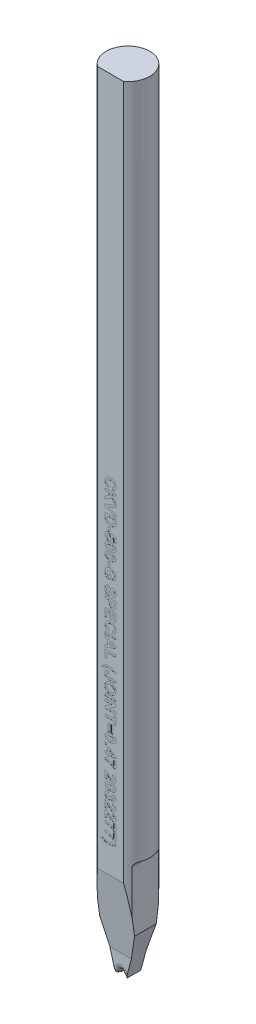
from build123d import *

# Parameters (mm, degrees)
SKETCH_TL_CUTTING_R       = 1.99771
TL_CUTTING_DEPTH          = 72.009
SKETCH_TDF_GRINDING_W     = 4.01542
SKETCH_TDF_GRINDING_H     = 4.01542
TDF_GRINDING_DEPTH        = 73.064400167
SKETCH_ENGRAVING_W        = 0.166666667
SKETCH_ENGRAVING_H        = 0.371794872
SKETCH_ENGRAVING_W_2      = 1
SKETCH_ENGRAVING_H_2      = 0.192307693
SKETCH_ENGRAVING_H_3      = 0.692307692
SKETCH_ENGRAVING_W_3      = 0.192307692
SKETCH_ENGRAVING_H_4      = 0.192307692
ENGRAVING_DEPTH           = 0.005
VW_VR_GRINDING_DEPTH      = 2.00771
VW_VR_GRINDING_DEPTH_BACK = 2.00771
ISA_GRINDING_DEPTH        = 2.00771
ISA_GRINDING_DEPTH_BACK   = 2.00771
PRE_FRX_BRX_DEPTH         = 2.00771
PRE_FRX_BRX_DEPTH_BACK    = 2.00771
SKETCH_PRE_FRX_BRX_W      = 1.33334
SKETCH_PRE_FRX_BRX_H      = 1.80086
FR_EDM_R                  = 0.50038
BR_EDM_R                  = 0.24892
FA_BA_GRINDING_DEPTH      = 2.00771
FA_BA_GRINDING_DEPTH_BACK = 2.00771


with BuildPart() as part:
    # sketch_TL_cutting → TL_cutting (new body)
    with BuildSketch(Plane(origin=(0, 0, 0), x_dir=(1, 0, 0), z_dir=(0, 1, 0))):
        Circle(SKETCH_TL_CUTTING_R)
    extrude(amount=TL_CUTTING_DEPTH)

    # sketch_TDF_grinding → TDF_grinding (cut, through all)
    with BuildSketch(Plane(origin=(0, 0, 0), x_dir=(1, 0, 0), z_dir=(0, 1, 0))):
        with Locations((0, -3.60918)):
            Rectangle(SKETCH_TDF_GRINDING_W, SKETCH_TDF_GRINDING_H)
    extrude(amount=TDF_GRINDING_DEPTH, mode=Mode.SUBTRACT)

    # sketch_engraving → engraving (cut)
    # profile 1 of 37: a face of its own
    with BuildSketch(Plane.XY.offset(1.60147)):
        with BuildLine():
            Line((-0.128205128, 39.265410256), (-0.192307692, 39.073102564))
            add(Edge.make_bspline(
                [(-0.192307692, 39.073102564), (-0.204917923, 39.077009052), (-0.229612721, 39.084659184), (-0.2649877, 39.098737804), (-0.297871332, 39.114732008), (-0.328259475, 39.132559875), (-0.356049464, 39.152295258), (-0.381471598, 39.173789244), (-0.404368127, 39.197253424), (-0.424673345, 39.222670624), (-0.442633936, 39.249763711), (-0.457816548, 39.278856053), (-0.470893242, 39.30951117), (-0.481488041, 39.342040557), (-0.489972889, 39.376228151), (-0.495577171, 39.412234413), (-0.499377062, 39.449890896), (-0.499789062, 39.475603283), (-0.5, 39.488767628)],
                knots=[0, 0, 0, 0, 1.126670901, 2.206376047, 3.246533763, 4.245677351, 5.210506282, 6.152793389, 7.083980095, 8.004497442, 8.926231833, 9.854395169, 10.801995143, 11.768203916, 12.771938831, 13.805609698, 14.87650608, 16, 16, 16, 16], degree=3))
            add(Edge.make_bspline(
                [(-0.5, 39.488767628), (-0.499663994, 39.505016309), (-0.499003061, 39.536977949), (-0.492350465, 39.583719052), (-0.481969511, 39.628260328), (-0.467601869, 39.670669613), (-0.448555271, 39.710648786), (-0.42571373, 39.748573108), (-0.398318662, 39.784009391), (-0.367249987, 39.817150716), (-0.332452821, 39.847279196), (-0.294134751, 39.873272297), (-0.253074131, 39.895810491), (-0.208709772, 39.913736594), (-0.161353037, 39.927821791), (-0.110975156, 39.937668328), (-0.057578507, 39.943834942), (-0.020984357, 39.944537083), (-0.002203526, 39.944897436)],
                knots=[0, 0, 0, 0, 1.025134988, 2.016471176, 2.973446247, 3.909197306, 4.836872559, 5.763618465, 6.698581235, 7.658772073, 8.627106982, 9.597494692, 10.576422683, 11.578339294, 12.6118974, 13.690673505, 14.814808564, 16, 16, 16, 16], degree=3))
            add(Edge.make_bspline(
                [(-0.002203526, 39.944897436), (0.017576475, 39.9445292), (0.056163648, 39.943810839), (0.112313555, 39.937762878), (0.165084042, 39.927716768), (0.214577853, 39.914140058), (0.260470573, 39.895929249), (0.303160692, 39.874073909), (0.342311169, 39.847956152), (0.377833814, 39.818031091), (0.409480853, 39.784897852), (0.437377469, 39.749193428), (0.460593243, 39.710691041), (0.479896446, 39.669867336), (0.494630503, 39.626423397), (0.505304611, 39.580476602), (0.511505561, 39.532006054), (0.512376199, 39.49886808), (0.512820513, 39.481956731)],
                knots=[0, 0, 0, 0, 1.212773307, 2.365899439, 3.458117515, 4.504331001, 5.50806732, 6.480562534, 7.440239902, 8.387651817, 9.323121479, 10.245404239, 11.160468186, 12.07454208, 13.009500751, 13.96802424, 14.963018902, 16, 16, 16, 16], degree=3))
            add(Edge.make_bspline(
                [(0.512820513, 39.481956731), (0.512448361, 39.467187276), (0.511718707, 39.438229796), (0.506761415, 39.395824506), (0.498061698, 39.355636158), (0.486319015, 39.317447521), (0.470821797, 39.281475987), (0.451884357, 39.247657111), (0.429606892, 39.215874651), (0.412205553, 39.196725065), (0.403445513, 39.187084936)],
                knots=[0, 0, 0, 0, 1.098510076, 2.153775193, 3.169777012, 4.153122333, 5.120892526, 6.076995459, 7.031936742, 8, 8, 8, 8], degree=3))
            add(Edge.make_bspline(
                [(0.403445513, 39.187084936), (0.39787141, 39.181497644), (0.386592274, 39.170191818), (0.367549896, 39.155095368), (0.347050772, 39.140782058), (0.324745215, 39.127479068), (0.30046466, 39.115606849), (0.274581981, 39.104594097), (0.246997406, 39.094455069), (0.227800247, 39.088816604), (0.217948718, 39.085923077)],
                knots=[0, 0, 0, 0, 0.885292881, 1.791380647, 2.722937556, 3.69093542, 4.703306561, 5.754477758, 6.847650944, 8, 8, 8, 8], degree=3))
            Line((0.217948718, 39.085923077), (0.179487179, 39.278230769))
            add(Edge.make_bspline(
                [(0.179487179, 39.278230769), (0.1857949, 39.279865288), (0.198219456, 39.283084861), (0.21607256, 39.28959955), (0.233014714, 39.297071208), (0.248625569, 39.3063361), (0.263619506, 39.316162074), (0.277222328, 39.327824773), (0.290109132, 39.340329754), (0.301694454, 39.354218861), (0.312145605, 39.369093589), (0.321339918, 39.384803983), (0.329014435, 39.401388478), (0.335156827, 39.418721754), (0.340319842, 39.436745702), (0.34350638, 39.455632147), (0.345953545, 39.475215752), (0.3460861, 39.488558875), (0.346153846, 39.495378205)],
                knots=[0, 0, 0, 0, 1.051114734, 2.070420253, 3.064047898, 4.034553068, 4.997066449, 5.953344811, 6.921213386, 7.892675544, 8.867420182, 9.852654213, 10.826683617, 11.811917648, 12.818610352, 13.848120519, 14.900229319, 16, 16, 16, 16], degree=3))
            add(Edge.make_bspline(
                [(0.346153846, 39.495378205), (0.345958725, 39.504742256), (0.345576529, 39.52308423), (0.341532101, 39.54981448), (0.335695112, 39.575255692), (0.326982094, 39.59931706), (0.315677399, 39.621931698), (0.302244603, 39.643428905), (0.286035184, 39.663260806), (0.26758257, 39.681899764), (0.246135655, 39.698607721), (0.221779967, 39.713310652), (0.194212535, 39.725504121), (0.163711493, 39.735404409), (0.130202077, 39.743196736), (0.093641969, 39.748761162), (0.054005962, 39.751838434), (0.026581025, 39.752333903), (0.012419872, 39.752589744)],
                knots=[0, 0, 0, 0, 0.93816214, 1.837638998, 2.704791736, 3.551915875, 4.396257554, 5.235807848, 6.087970119, 6.959042444, 7.860386085, 8.80649345, 9.804409709, 10.875695391, 12.017327537, 13.250155505, 14.580089023, 16, 16, 16, 16], degree=3))
            add(Edge.make_bspline(
                [(0.012419872, 39.752589744), (-0.002609028, 39.752336423), (-0.031567402, 39.751848312), (-0.073337178, 39.748771685), (-0.111754322, 39.743171705), (-0.14688701, 39.735482849), (-0.178713725, 39.725532973), (-0.207179389, 39.713359106), (-0.23231734, 39.698886701), (-0.254110839, 39.682138275), (-0.272831387, 39.663537256), (-0.288926796, 39.643587439), (-0.302688307, 39.622406524), (-0.314010391, 39.599867053), (-0.322575422, 39.575883298), (-0.328786932, 39.550652371), (-0.332735688, 39.524081695), (-0.333131326, 39.505875799), (-0.333333333, 39.496580128)],
                knots=[0, 0, 0, 0, 1.475208372, 2.842499301, 4.107722225, 5.282836115, 6.369007568, 7.375918121, 8.315702116, 9.208439171, 10.065831443, 10.90006451, 11.71996243, 12.54067204, 13.369972975, 14.214060185, 15.088124569, 16, 16, 16, 16], degree=3))
            add(Edge.make_bspline(
                [(-0.333333333, 39.496580128), (-0.333161634, 39.489697953), (-0.332824013, 39.476165176), (-0.330681155, 39.456162689), (-0.326591822, 39.43696438), (-0.321184418, 39.418476281), (-0.314399721, 39.400626559), (-0.305696319, 39.38368748), (-0.295693052, 39.367325777), (-0.283969989, 39.35188094), (-0.270808612, 39.337146156), (-0.255597341, 39.323707159), (-0.238701667, 39.311241373), (-0.220008678, 39.299906947), (-0.199678377, 39.28932516), (-0.177394008, 39.280322121), (-0.153515697, 39.271934984), (-0.136789345, 39.267623153), (-0.128205128, 39.265410256)],
                knots=[0, 0, 0, 0, 0.980177776, 1.927374078, 2.859849964, 3.771585772, 4.668674471, 5.574490016, 6.479656464, 7.396337719, 8.332153134, 9.288470092, 10.28125149, 11.318486971, 12.398724812, 13.541284404, 14.738150009, 16, 16, 16, 16], degree=3))
        make_face()
    # profile 2 of 37: a face of its own
    with BuildSketch(Plane.XY.offset(1.60147)):
        Polygon((-0.5, 38.906435897), (0.5, 38.906435897), (0.5, 38.714128205), (0.052283654, 38.714128205), (0.5, 38.292453526), (0.5, 38.028230769), (0.11338141, 38.408038462), (-0.5, 38.015410256), (-0.5, 38.271620192), (-0.035456731, 38.553871795), (-0.198517628, 38.714128205), (-0.5, 38.714128205), align=None)
    # profile 3 of 37: a face of its own
    with BuildSketch(Plane.XY.offset(1.60147)):
        Polygon((-0.5, 37.639208333), (0.5, 38.009), (0.5, 37.805875), (-0.243589744, 37.541051282), (0.5, 37.277229167), (0.5, 37.073102564), (-0.5, 37.441491987), align=None)
    # profile 4 of 37: a face of its own
    with BuildSketch(Plane.XY.offset(1.60147)):
        with BuildLine():
            Line((0.5, 36.983358974), (0.5, 36.616572115))
            add(Edge.make_bspline(
                [(0.5, 36.616572115), (0.500005193, 36.606554571), (0.500015306, 36.587048084), (0.498840892, 36.558739066), (0.497659587, 36.532266494), (0.495294873, 36.507706352), (0.492816233, 36.484973432), (0.489678088, 36.464026942), (0.485656212, 36.444999202), (0.482484481, 36.433000319), (0.480969551, 36.427269231)],
                knots=[0, 0, 0, 0, 1.259756885, 2.453039283, 3.563158368, 4.591894114, 5.55549294, 6.43918076, 7.254497783, 8, 8, 8, 8], degree=3))
            add(Edge.make_bspline(
                [(0.480969551, 36.427269231), (0.478637325, 36.420100254), (0.474014881, 36.405891431), (0.465827813, 36.385038378), (0.455960096, 36.365204479), (0.445111978, 36.345929819), (0.432903728, 36.327657553), (0.419595761, 36.309942873), (0.404753223, 36.293309803), (0.383633179, 36.27177514), (0.35420815, 36.247350255), (0.315375005, 36.22151972), (0.272594656, 36.199782014), (0.234409605, 36.184590641), (0.20183843, 36.174546542), (0.175754603, 36.167978141), (0.148301213, 36.162306468), (0.119383738, 36.158056292), (0.08913491, 36.154394906), (0.057465542, 36.151767238), (0.024383276, 36.15046625), (0.001870575, 36.150174494), (-0.009615385, 36.150025641)],
                knots=[0, 0, 0, 0, 0.745431882, 1.477436776, 2.212739876, 2.934276521, 3.663147754, 4.384200836, 5.123377481, 5.865761747, 7.365547505, 8.894711587, 10.468722596, 12.101948761, 12.951987285, 13.837595333, 14.760899389, 15.722756883, 16.726861385, 17.773652936, 18.864119771, 20, 20, 20, 20], degree=3))
            add(Edge.make_bspline(
                [(-0.009615385, 36.150025641), (-0.0294616, 36.150417046), (-0.067834928, 36.15117384), (-0.123301552, 36.156771211), (-0.17465514, 36.166066648), (-0.206804138, 36.175777075), (-0.222355769, 36.180474359)],
                knots=[0, 0, 0, 0, 1.103491527, 2.133638164, 3.0971734, 4, 4, 4, 4], degree=3))
            add(Edge.make_bspline(
                [(-0.222355769, 36.180474359), (-0.231274521, 36.183648003), (-0.248819098, 36.189891057), (-0.274127236, 36.200815932), (-0.298211673, 36.212620337), (-0.321053432, 36.225402184), (-0.342549771, 36.239226052), (-0.362636394, 36.254143645), (-0.381577746, 36.269923731), (-0.393236239, 36.28135549), (-0.399038462, 36.287044872)],
                knots=[0, 0, 0, 0, 1.090884612, 2.145940218, 3.175104604, 4.181306866, 5.161203701, 6.118658341, 7.063689906, 8, 8, 8, 8], degree=3))
            add(Edge.make_bspline(
                [(-0.399038462, 36.287044872), (-0.407300305, 36.296331145), (-0.424264154, 36.315398431), (-0.445652736, 36.34874995), (-0.464086504, 36.386625276), (-0.473760833, 36.413939168), (-0.478766026, 36.428070513)],
                knots=[0, 0, 0, 0, 0.912008655, 1.872605891, 2.89935344, 4, 4, 4, 4], degree=3))
            add(Edge.make_bspline(
                [(-0.478766026, 36.428070513), (-0.4805228, 36.433790486), (-0.484168894, 36.445661996), (-0.488062998, 36.464485444), (-0.492165475, 36.484579947), (-0.49463687, 36.506177223), (-0.497243066, 36.529053081), (-0.498706299, 36.553389822), (-0.49974511, 36.579103081), (-0.499913777, 36.596739175), (-0.5, 36.605754808)],
                knots=[0, 0, 0, 0, 0.799129865, 1.658552685, 2.566799617, 3.538529252, 4.561352959, 5.643373779, 6.795284424, 8, 8, 8, 8], degree=3))
            Line((-0.5, 36.605754808), (-0.5, 36.983358974))
            Line((-0.5, 36.983358974), (0.5, 36.983358974))
        make_face()
        with BuildLine():
            Line((0.333333333, 36.791051282), (-0.333333333, 36.791051282))
            Line((-0.333333333, 36.791051282), (-0.333333333, 36.632798077))
            add(Edge.make_bspline(
                [(-0.333333333, 36.632798077), (-0.333276671, 36.62565336), (-0.333167574, 36.611897049), (-0.332847006, 36.591991316), (-0.331979167, 36.573698115), (-0.331080228, 36.556921614), (-0.329595022, 36.54170549), (-0.328134266, 36.527983535), (-0.326090699, 36.515832132), (-0.324477534, 36.508327127), (-0.323717949, 36.504793269)],
                knots=[0, 0, 0, 0, 1.333384787, 2.567275092, 3.714769766, 4.750907381, 5.701951617, 6.567520054, 7.325492842, 8, 8, 8, 8], degree=3))
            add(Edge.make_bspline(
                [(-0.323717949, 36.504793269), (-0.321509316, 36.496516575), (-0.317207482, 36.480395757), (-0.307617456, 36.457760499), (-0.296048139, 36.437278507), (-0.282136533, 36.41860677), (-0.26455548, 36.40177967), (-0.242070693, 36.387415683), (-0.215254411, 36.374122192), (-0.189584523, 36.365018806), (-0.16665678, 36.358484413), (-0.147412959, 36.354061165), (-0.126593091, 36.350565591), (-0.104279343, 36.347558942), (-0.080500412, 36.345129499), (-0.055170426, 36.343617784), (-0.028320392, 36.342586029), (-0.009883527, 36.342419161), (-0.000400641, 36.342333333)],
                knots=[0, 0, 0, 0, 1.038686998, 2.023088296, 2.974059649, 3.888265163, 4.839857954, 5.909819677, 7.113156087, 8.466843969, 9.20827164, 10.006482943, 10.861893492, 11.769681931, 12.739021491, 13.762258324, 14.849031541, 16, 16, 16, 16], degree=3))
            add(Edge.make_bspline(
                [(-0.000400641, 36.342333333), (0.009082275, 36.3424185), (0.027452469, 36.342583485), (0.054102292, 36.343613664), (0.079033415, 36.345116863), (0.102276578, 36.347563691), (0.123864169, 36.350523456), (0.143813574, 36.354060891), (0.161996804, 36.358454423), (0.183589283, 36.365007511), (0.207947697, 36.374844996), (0.23429421, 36.388671199), (0.2571147, 36.404936402), (0.276689574, 36.423291558), (0.29287817, 36.444378569), (0.306422028, 36.467749371), (0.316938162, 36.493880279), (0.321416742, 36.512469318), (0.323717949, 36.522020833)],
                knots=[0, 0, 0, 0, 1.118059345, 2.165891593, 3.144157881, 4.062285166, 4.920717571, 5.712910489, 6.449981617, 7.12489426, 8.371943983, 9.541298068, 10.624898781, 11.666293176, 12.69306237, 13.747704633, 14.842713931, 16, 16, 16, 16], degree=3))
            add(Edge.make_bspline(
                [(0.323717949, 36.522020833), (0.324486218, 36.526155143), (0.326177652, 36.535257311), (0.328151987, 36.550361571), (0.329628909, 36.568148179), (0.331099472, 36.588577116), (0.331977905, 36.611627064), (0.332859431, 36.637332571), (0.333166326, 36.665716851), (0.333276065, 36.685549207), (0.333333333, 36.695899038)],
                knots=[0, 0, 0, 0, 0.578739524, 1.274162912, 2.095457587, 3.035141998, 4.093102578, 5.270121571, 6.575369351, 8, 8, 8, 8], degree=3))
            Line((0.333333333, 36.695899038), (0.333333333, 36.791051282))
        make_face(mode=Mode.SUBTRACT)
    # profile 5 of 37: a face of its own
    with BuildSketch(Plane.XY.offset(1.60147)):
        with Locations((-0.147435898, 35.823102564)):
            Rectangle(SKETCH_ENGRAVING_W, SKETCH_ENGRAVING_H)
    # profile 6 of 37: a face of its own
    with BuildSketch(Plane.XY.offset(1.60147)):
        with BuildLine():
            Line((-0.213942308, 35.573102564), (-0.192307692, 35.406435897))
            add(Edge.make_bspline(
                [(-0.192307692, 35.406435897), (-0.203607347, 35.404586826), (-0.225366694, 35.401026133), (-0.255826929, 35.390063828), (-0.282470914, 35.374435917), (-0.305088238, 35.354761759), (-0.323334969, 35.332318846), (-0.336523954, 35.307649962), (-0.344692684, 35.281280099), (-0.34566455, 35.262996649), (-0.346153846, 35.253791667)],
                knots=[0, 0, 0, 0, 1.155217688, 2.224562036, 3.249849536, 4.259092678, 5.238040954, 6.15568152, 7.071459712, 8, 8, 8, 8], degree=3))
            add(Edge.make_bspline(
                [(-0.346153846, 35.253791667), (-0.346059894, 35.248443112), (-0.34587598, 35.237973234), (-0.34378776, 35.222544535), (-0.340396301, 35.20780521), (-0.335789422, 35.193618977), (-0.329745146, 35.180121981), (-0.322266898, 35.16729854), (-0.313608966, 35.15499075), (-0.303697677, 35.143355274), (-0.29215854, 35.13291258), (-0.27939506, 35.123638023), (-0.265101057, 35.116050338), (-0.249674797, 35.109508976), (-0.232663378, 35.104881315), (-0.214481969, 35.101169692), (-0.194883734, 35.099284068), (-0.18142672, 35.098927617), (-0.174479167, 35.09874359)],
                knots=[0, 0, 0, 0, 0.98109136, 1.920501424, 2.850996269, 3.75396817, 4.653607445, 5.559568228, 6.474190795, 7.412641135, 8.358186253, 9.324081521, 10.300185094, 11.322066343, 12.392681767, 13.529496655, 14.72453472, 16, 16, 16, 16], degree=3))
            add(Edge.make_bspline(
                [(-0.174479167, 35.09874359), (-0.167930185, 35.098847549), (-0.155273198, 35.099048469), (-0.136935362, 35.10091253), (-0.119798482, 35.103773852), (-0.103987864, 35.108325768), (-0.089209555, 35.113524403), (-0.075987454, 35.120533513), (-0.063746794, 35.128224163), (-0.053149329, 35.13759838), (-0.04378212, 35.147810732), (-0.035449479, 35.158693065), (-0.028416647, 35.170390594), (-0.022600846, 35.18279263), (-0.018105451, 35.195952809), (-0.015265585, 35.209899831), (-0.013079926, 35.224477064), (-0.012907894, 35.234485328), (-0.012820513, 35.23956891)],
                knots=[0, 0, 0, 0, 1.292262537, 2.497510385, 3.635136149, 4.715991128, 5.741845981, 6.720379908, 7.663568786, 8.58853187, 9.502632107, 10.396263742, 11.289117461, 12.191261909, 13.095714127, 14.026387781, 14.997526353, 16, 16, 16, 16], degree=3))
            add(Edge.make_bspline(
                [(-0.012820513, 35.23956891), (-0.013050924, 35.245995741), (-0.013510598, 35.25881737), (-0.017247301, 35.277744398), (-0.02333068, 35.29616685), (-0.031799166, 35.314065577), (-0.042720432, 35.331393226), (-0.056130694, 35.348074776), (-0.071799231, 35.364396575), (-0.083638008, 35.374422371), (-0.08974359, 35.379592949)],
                knots=[0, 0, 0, 0, 0.931687088, 1.85873035, 2.786835662, 3.740075265, 4.723687035, 5.750832598, 6.840042753, 8, 8, 8, 8], degree=3))
            Line((-0.08974359, 35.379592949), (-0.066105769, 35.547461538))
            Line((-0.066105769, 35.547461538), (0.487179487, 35.432076923))
            Line((0.487179487, 35.432076923), (0.487179487, 34.944897436))
            Line((0.487179487, 34.944897436), (0.294871795, 34.944897436))
            Line((0.294871795, 34.944897436), (0.294871795, 35.277830128))
            Line((0.294871795, 35.277830128), (0.116386218, 35.317092949))
            add(Edge.make_bspline(
                [(0.116386218, 35.317092949), (0.122158957, 35.307087656), (0.133400829, 35.287603282), (0.144973305, 35.25649635), (0.152400706, 35.225229621), (0.153366831, 35.204152487), (0.153846154, 35.193695513)],
                knots=[0, 0, 0, 0, 1.060051984, 2.064352337, 3.039669322, 4, 4, 4, 4], degree=3))
            add(Edge.make_bspline(
                [(0.153846154, 35.193695513), (0.153581613, 35.183865068), (0.153059042, 35.164446132), (0.148771515, 35.135966641), (0.141705229, 35.108649395), (0.131871753, 35.08240215), (0.118982632, 35.057412644), (0.103404168, 35.033465451), (0.084866032, 35.010906296), (0.063903438, 34.989492789), (0.04071085, 34.969965174), (0.015420507, 34.953101525), (-0.011337699, 34.938536215), (-0.039859413, 34.926678326), (-0.070184315, 34.917748996), (-0.102051282, 34.91106179), (-0.135661543, 34.907315665), (-0.158578281, 34.906733149), (-0.170272436, 34.906435897)],
                knots=[0, 0, 0, 0, 0.974409932, 1.924837087, 2.848242317, 3.768103797, 4.697919751, 5.630842317, 6.595644344, 7.588240789, 8.59876155, 9.595918743, 10.597287627, 11.615415169, 12.652315553, 13.727511434, 14.840374562, 16, 16, 16, 16], degree=3))
            add(Edge.make_bspline(
                [(-0.170272436, 34.906435897), (-0.180095164, 34.90670219), (-0.199591316, 34.907230727), (-0.228431015, 34.910374662), (-0.256480502, 34.916084756), (-0.283660862, 34.923892183), (-0.310181667, 34.93373598), (-0.335760069, 34.945979792), (-0.360613268, 34.960472719), (-0.376286294, 34.971679985), (-0.384214744, 34.977349359)],
                knots=[0, 0, 0, 0, 1.0275977, 2.039576086, 3.029943557, 4.018141221, 4.995043124, 5.985410594, 6.980887897, 8, 8, 8, 8], degree=3))
            add(Edge.make_bspline(
                [(-0.384214744, 34.977349359), (-0.39442561, 34.985610871), (-0.414521783, 35.001870487), (-0.440928765, 35.029712796), (-0.463196136, 35.060010934), (-0.481238657, 35.092734524), (-0.495700415, 35.127611763), (-0.505577236, 35.165007561), (-0.511741284, 35.20464131), (-0.51245553, 35.231866597), (-0.512820513, 35.245778846)],
                knots=[0, 0, 0, 0, 1.018155984, 2.003849412, 2.967446846, 3.927472908, 4.896208823, 5.888955604, 6.921246412, 8, 8, 8, 8], degree=3))
            add(Edge.make_bspline(
                [(-0.512820513, 35.245778846), (-0.51261689, 35.257007919), (-0.512219305, 35.278933296), (-0.508313832, 35.311046963), (-0.50189785, 35.341525845), (-0.493201931, 35.370514952), (-0.481586571, 35.397739005), (-0.467806969, 35.423532218), (-0.451267563, 35.447697806), (-0.432181131, 35.470093624), (-0.411081442, 35.490657914), (-0.387995531, 35.509000686), (-0.363308362, 35.52532086), (-0.336770788, 35.539307199), (-0.308568836, 35.551226858), (-0.278557994, 35.560717794), (-0.246938394, 35.568532152), (-0.225062746, 35.57156223), (-0.213942308, 35.573102564)],
                knots=[0, 0, 0, 0, 1.098896741, 2.145655864, 3.16104256, 4.145315902, 5.10323158, 6.053780891, 7.003858069, 7.963890296, 8.930045353, 9.883557002, 10.846278307, 11.82296847, 12.816080213, 13.83936887, 14.901647787, 16, 16, 16, 16], degree=3))
        make_face()
    # profile 7 of 37: a face of its own
    with BuildSketch(Plane.XY.offset(1.60147)):
        with BuildLine():
            add(Edge.make_bspline(
                [(0.5, 34.476948718), (0.49971384, 34.465044998), (0.499156721, 34.441869821), (0.494192381, 34.408107508), (0.486315205, 34.376354925), (0.474936732, 34.346605943), (0.460535804, 34.318709267), (0.442472771, 34.293057415), (0.421624591, 34.26905643), (0.405435577, 34.255200797), (0.397235577, 34.248182692)],
                knots=[0, 0, 0, 0, 1.098626248, 2.138899374, 3.143835643, 4.113754749, 5.073488057, 6.034745239, 7.004566348, 8, 8, 8, 8], degree=3))
            add(Edge.make_bspline(
                [(0.397235577, 34.248182692), (0.392013767, 34.244167993), (0.381356969, 34.235974695), (0.364136726, 34.22494029), (0.345869985, 34.214331685), (0.326116385, 34.205073442), (0.305221356, 34.196200078), (0.283126793, 34.188009313), (0.259707844, 34.18077695), (0.235071142, 34.174472124), (0.209179241, 34.168578627), (0.181968999, 34.163641398), (0.15350924, 34.159415972), (0.123831018, 34.156120738), (0.092992495, 34.153166339), (0.060842825, 34.151549757), (0.027454838, 34.150225267), (0.004742429, 34.150092949), (-0.006810897, 34.150025641)],
                knots=[0, 0, 0, 0, 0.746775751, 1.524038446, 2.317840886, 3.141016509, 3.996283186, 4.892488336, 5.812382473, 6.774967264, 7.776368117, 8.823659909, 9.910833035, 11.039122168, 12.210293276, 13.424012874, 14.68964937, 16, 16, 16, 16], degree=3))
            add(Edge.make_bspline(
                [(-0.006810897, 34.150025641), (-0.01836425, 34.150091934), (-0.041009977, 34.150221876), (-0.074330982, 34.151554693), (-0.106413621, 34.153167781), (-0.13725379, 34.156113853), (-0.166926114, 34.159440728), (-0.195353975, 34.163546272), (-0.22243919, 34.168864764), (-0.248289812, 34.174671418), (-0.27303117, 34.180936077), (-0.296407841, 34.1884899), (-0.318777777, 34.196350303), (-0.339699687, 34.205429898), (-0.359477735, 34.215020372), (-0.377930928, 34.225471112), (-0.395257891, 34.236628726), (-0.40597091, 34.244901289), (-0.411258013, 34.248983974)],
                knots=[0, 0, 0, 0, 1.308411734, 2.564617834, 3.776541518, 4.94597967, 6.0725993, 7.15816376, 8.197872509, 9.197791611, 10.158952087, 11.086962723, 11.979249638, 12.843171697, 13.668427753, 14.467630577, 15.243743175, 16, 16, 16, 16], degree=3))
            add(Edge.make_bspline(
                [(-0.411258013, 34.248983974), (-0.419387722, 34.255937875), (-0.435436162, 34.269665209), (-0.456111536, 34.293400465), (-0.473801555, 34.3190109), (-0.487914093, 34.346857064), (-0.499368982, 34.376461236), (-0.506993451, 34.408265546), (-0.511967929, 34.441935616), (-0.512532265, 34.465111213), (-0.512820513, 34.476948718)],
                knots=[0, 0, 0, 0, 0.991667276, 1.957599061, 2.911530233, 3.873218945, 4.847995157, 5.850445929, 6.902062539, 8, 8, 8, 8], degree=3))
            add(Edge.make_bspline(
                [(-0.512820513, 34.476948718), (-0.512476011, 34.488921133), (-0.511800941, 34.512381702), (-0.506449472, 34.546635149), (-0.497876451, 34.579194622), (-0.485636462, 34.609943234), (-0.469774335, 34.638836989), (-0.45076002, 34.666101616), (-0.427732542, 34.691143948), (-0.40629523, 34.710749361), (-0.386925042, 34.725092741), (-0.37086259, 34.735209036), (-0.353675124, 34.744985358), (-0.33482528, 34.753423499), (-0.314870578, 34.761748475), (-0.293380967, 34.769121787), (-0.270541238, 34.775626959), (-0.246455682, 34.781734901), (-0.220958398, 34.786828025), (-0.194124629, 34.791512952), (-0.165840258, 34.795204927), (-0.136262825, 34.798478243), (-0.105322509, 34.800782844), (-0.073069943, 34.802654475), (-0.039401887, 34.803592969), (-0.01649349, 34.803777608), (-0.004807692, 34.803871795)],
                knots=[0, 0, 0, 0, 1.257818097, 2.464759732, 3.634271214, 4.790227596, 5.933394726, 7.09190477, 8.274482889, 9.50191983, 10.139172818, 10.805000628, 11.49619854, 12.215266328, 12.973768034, 13.768328009, 14.601232062, 15.469317089, 16.379095881, 17.333267023, 18.331755967, 19.376479622, 20.460535752, 21.592206075, 22.771760786, 24, 24, 24, 24], degree=3))
            add(Edge.make_bspline(
                [(-0.004807692, 34.803871795), (0.006678925, 34.803806), (0.02919122, 34.803677052), (0.062378132, 34.802334948), (0.094328674, 34.800741634), (0.12509981, 34.79776902), (0.154640959, 34.794469515), (0.183004063, 34.790356894), (0.209982531, 34.784938814), (0.235876189, 34.779589743), (0.260431507, 34.772849782), (0.2837906, 34.765424475), (0.306110518, 34.757590136), (0.326924245, 34.748417854), (0.346659803, 34.738882898), (0.365109758, 34.728424838), (0.382437536, 34.717269066), (0.39315045, 34.708996265), (0.3984375, 34.704913462)],
                knots=[0, 0, 0, 0, 1.304443357, 2.556541329, 3.771813033, 4.936929721, 6.066661712, 7.147723817, 8.190304831, 9.191350322, 10.149780912, 11.080355239, 11.975107155, 12.834450748, 13.66198663, 14.463397305, 15.241653965, 16, 16, 16, 16], degree=3))
            add(Edge.make_bspline(
                [(0.3984375, 34.704913462), (0.406566428, 34.697959179), (0.422613323, 34.684231089), (0.443299998, 34.660501361), (0.460913987, 34.634919209), (0.475197493, 34.607154301), (0.486497465, 34.577482107), (0.494183265, 34.545636121), (0.499144648, 34.511960686), (0.499710816, 34.488785839), (0.5, 34.476948718)],
                knots=[0, 0, 0, 0, 0.991631672, 1.957528776, 2.911425699, 3.867574088, 4.848108326, 5.850523106, 6.902101959, 8, 8, 8, 8], degree=3))
        make_face()
        with BuildLine():
            add(Edge.make_bspline(
                [(0.333333333, 34.476948718), (0.333068079, 34.483116684), (0.332548986, 34.495187158), (0.328316127, 34.512742094), (0.321759633, 34.529323165), (0.312130705, 34.544881206), (0.299093083, 34.55928978), (0.281476094, 34.571497658), (0.259881539, 34.582051162), (0.243736, 34.587330771), (0.235176282, 34.590129808)],
                knots=[0, 0, 0, 0, 0.909107913, 1.77908945, 2.650019014, 3.530482969, 4.465025013, 5.495890128, 6.672421267, 8, 8, 8, 8], degree=3))
            add(Edge.make_bspline(
                [(0.235176282, 34.590129808), (0.228718042, 34.591877997), (0.214837576, 34.595635317), (0.192206647, 34.59989972), (0.166522939, 34.603416485), (0.137792419, 34.606386038), (0.105999886, 34.608802628), (0.071125109, 34.610290848), (0.033192525, 34.611319478), (0.006878451, 34.611480391), (-0.006810897, 34.611564103)],
                knots=[0, 0, 0, 0, 0.658986521, 1.416336438, 2.266694271, 3.212608458, 4.261595115, 5.407496572, 6.651304179, 8, 8, 8, 8], degree=3))
            add(Edge.make_bspline(
                [(-0.006810897, 34.611564103), (-0.020433943, 34.611573117), (-0.046549094, 34.611590397), (-0.084006477, 34.610416163), (-0.118154033, 34.60924872), (-0.148991056, 34.606879061), (-0.176626244, 34.604540892), (-0.200847568, 34.601003343), (-0.221857789, 34.597450608), (-0.244486895, 34.591417153), (-0.268257705, 34.583101394), (-0.292448985, 34.571872977), (-0.311537375, 34.559207058), (-0.325415776, 34.544675587), (-0.334597404, 34.528930329), (-0.341538269, 34.512626395), (-0.345246665, 34.495074555), (-0.345848983, 34.483040013), (-0.346153846, 34.476948718)],
                knots=[0, 0, 0, 0, 1.613038927, 3.092168624, 4.43749063, 5.658264602, 6.75425577, 7.720394221, 8.556328411, 9.275513998, 10.490872946, 11.534172084, 12.42681833, 13.187531851, 13.88996177, 14.574222125, 15.278341114, 16, 16, 16, 16], degree=3))
            add(Edge.make_bspline(
                [(-0.346153846, 34.476948718), (-0.345874419, 34.47085088), (-0.345321688, 34.458788799), (-0.341225408, 34.441256833), (-0.334465655, 34.424699336), (-0.325029126, 34.409036493), (-0.311901617, 34.39461441), (-0.294300445, 34.382397614), (-0.272700888, 34.37184693), (-0.25655611, 34.366566893), (-0.247996795, 34.363767628)],
                knots=[0, 0, 0, 0, 0.899391665, 1.779078861, 2.640979247, 3.529945348, 4.464599804, 5.495588918, 6.672261578, 8, 8, 8, 8], degree=3))
            add(Edge.make_bspline(
                [(-0.247996795, 34.363767628), (-0.241538043, 34.362021968), (-0.227719754, 34.358287186), (-0.205229709, 34.353992396), (-0.179679092, 34.35046611), (-0.151079269, 34.347524791), (-0.11935541, 34.345084431), (-0.084546407, 34.343608845), (-0.046680798, 34.342579247), (-0.020433482, 34.342417356), (-0.006810897, 34.342333333)],
                knots=[0, 0, 0, 0, 0.66114423, 1.414496391, 2.261103113, 3.210114492, 4.255954433, 5.405607896, 6.653488082, 8, 8, 8, 8], degree=3))
            add(Edge.make_bspline(
                [(-0.006810897, 34.342333333), (0.006810741, 34.342447109), (0.032921137, 34.342665199), (0.070464093, 34.343292091), (0.104645163, 34.345047006), (0.13553417, 34.346803226), (0.163028833, 34.349768631), (0.187277888, 34.352711537), (0.208178651, 34.356783667), (0.23096624, 34.362375697), (0.254848985, 34.37071368), (0.278913284, 34.38228584), (0.298191428, 34.39472291), (0.312146257, 34.409229879), (0.321683592, 34.424948044), (0.328364426, 34.441400374), (0.332523972, 34.458849531), (0.333060584, 34.47084941), (0.333333333, 34.476948718)],
                knots=[0, 0, 0, 0, 1.611458614, 3.088895909, 4.441089836, 5.660086535, 6.747875232, 7.711965119, 8.548505902, 9.26500436, 10.486583113, 11.532259092, 12.419544583, 13.184925779, 13.890764661, 14.581638641, 15.279074115, 16, 16, 16, 16], degree=3))
        make_face(mode=Mode.SUBTRACT)
    # profile 8 of 37: a face of its own
    with BuildSketch(Plane.XY.offset(1.60147)):
        with BuildLine():
            add(Edge.make_bspline(
                [(0.5, 33.707717949), (0.49971384, 33.695814229), (0.499156721, 33.672639051), (0.494192381, 33.638876739), (0.486315205, 33.607124156), (0.474936732, 33.577375173), (0.460535804, 33.549478497), (0.442472771, 33.523826646), (0.421624591, 33.499825661), (0.405435577, 33.485970028), (0.397235577, 33.478951923)],
                knots=[0, 0, 0, 0, 1.098626248, 2.138899374, 3.143835643, 4.113754749, 5.073488057, 6.034745239, 7.004566348, 8, 8, 8, 8], degree=3))
            add(Edge.make_bspline(
                [(0.397235577, 33.478951923), (0.392013767, 33.474937224), (0.381356969, 33.466743926), (0.364136726, 33.45570952), (0.345869985, 33.445100915), (0.326116385, 33.435842673), (0.305221356, 33.426969309), (0.283126793, 33.418778544), (0.259707844, 33.41154618), (0.235071142, 33.405241354), (0.209179241, 33.399347858), (0.181968999, 33.394410628), (0.15350924, 33.390185203), (0.123831018, 33.386889969), (0.092992495, 33.38393557), (0.060842825, 33.382318988), (0.027454838, 33.380994498), (0.004742429, 33.380862179), (-0.006810897, 33.380794872)],
                knots=[0, 0, 0, 0, 0.746775751, 1.524038446, 2.317840886, 3.141016509, 3.996283186, 4.892488336, 5.812382473, 6.774967264, 7.776368117, 8.823659909, 9.910833035, 11.039122168, 12.210293276, 13.424012874, 14.68964937, 16, 16, 16, 16], degree=3))
            add(Edge.make_bspline(
                [(-0.006810897, 33.380794872), (-0.01836425, 33.380861165), (-0.041009977, 33.380991107), (-0.074330982, 33.382323924), (-0.106413621, 33.383937012), (-0.13725379, 33.386883084), (-0.166926114, 33.390209959), (-0.195353975, 33.394315503), (-0.22243919, 33.399633995), (-0.248289812, 33.405440649), (-0.27303117, 33.411705308), (-0.296407841, 33.419259131), (-0.318777777, 33.427119533), (-0.339699687, 33.436199129), (-0.359477735, 33.445789602), (-0.377930928, 33.456240342), (-0.395257891, 33.467397957), (-0.40597091, 33.47567052), (-0.411258013, 33.479753205)],
                knots=[0, 0, 0, 0, 1.308411734, 2.564617834, 3.776541518, 4.94597967, 6.0725993, 7.15816376, 8.197872509, 9.197791611, 10.158952087, 11.086962723, 11.979249638, 12.843171697, 13.668427753, 14.467630577, 15.243743175, 16, 16, 16, 16], degree=3))
            add(Edge.make_bspline(
                [(-0.411258013, 33.479753205), (-0.419387722, 33.486707105), (-0.435436162, 33.50043444), (-0.456111536, 33.524169695), (-0.473801555, 33.549780131), (-0.487914093, 33.577626295), (-0.499368982, 33.607230467), (-0.506993451, 33.639034777), (-0.511967929, 33.672704847), (-0.512532265, 33.695880444), (-0.512820513, 33.707717949)],
                knots=[0, 0, 0, 0, 0.991667276, 1.957599061, 2.911530233, 3.873218945, 4.847995157, 5.850445929, 6.902062539, 8, 8, 8, 8], degree=3))
            add(Edge.make_bspline(
                [(-0.512820513, 33.707717949), (-0.512476011, 33.719690364), (-0.511800941, 33.743150933), (-0.506449472, 33.777404379), (-0.497876451, 33.809963853), (-0.485636462, 33.840712465), (-0.469774335, 33.86960622), (-0.45076002, 33.896870847), (-0.427732542, 33.921913179), (-0.40629523, 33.941518592), (-0.386925042, 33.955861971), (-0.37086259, 33.965978267), (-0.353675124, 33.975754589), (-0.33482528, 33.98419273), (-0.314870578, 33.992517706), (-0.293380967, 33.999891018), (-0.270541238, 34.00639619), (-0.246455682, 34.012504132), (-0.220958398, 34.017597256), (-0.194124629, 34.022282183), (-0.165840258, 34.025974157), (-0.136262825, 34.029247473), (-0.105322509, 34.031552075), (-0.073069943, 34.033423706), (-0.039401887, 34.0343622), (-0.01649349, 34.034546839), (-0.004807692, 34.034641026)],
                knots=[0, 0, 0, 0, 1.257818097, 2.464759732, 3.634271214, 4.790227596, 5.933394726, 7.09190477, 8.274482889, 9.50191983, 10.139172818, 10.805000628, 11.49619854, 12.215266328, 12.973768034, 13.768328009, 14.601232062, 15.469317089, 16.379095881, 17.333267023, 18.331755967, 19.376479622, 20.460535752, 21.592206075, 22.771760786, 24, 24, 24, 24], degree=3))
            add(Edge.make_bspline(
                [(-0.004807692, 34.034641026), (0.006678925, 34.034575231), (0.02919122, 34.034446282), (0.062378132, 34.033104179), (0.094328674, 34.031510865), (0.12509981, 34.028538251), (0.154640959, 34.025238746), (0.183004063, 34.021126125), (0.209982531, 34.015708045), (0.235876189, 34.010358974), (0.260431507, 34.003619013), (0.2837906, 33.996193706), (0.306110518, 33.988359367), (0.326924245, 33.979187084), (0.346659803, 33.969652128), (0.365109758, 33.959194069), (0.382437536, 33.948038297), (0.39315045, 33.939765495), (0.3984375, 33.935682692)],
                knots=[0, 0, 0, 0, 1.304443357, 2.556541329, 3.771813033, 4.936929721, 6.066661712, 7.147723817, 8.190304831, 9.191350322, 10.149780912, 11.080355239, 11.975107155, 12.834450748, 13.66198663, 14.463397305, 15.241653965, 16, 16, 16, 16], degree=3))
            add(Edge.make_bspline(
                [(0.3984375, 33.935682692), (0.406566428, 33.92872841), (0.422613323, 33.91500032), (0.443299998, 33.891270592), (0.460913987, 33.865688439), (0.475197493, 33.837923532), (0.486497465, 33.808251338), (0.494183265, 33.776405352), (0.499144648, 33.742729916), (0.499710816, 33.71955507), (0.5, 33.707717949)],
                knots=[0, 0, 0, 0, 0.991631672, 1.957528776, 2.911425699, 3.867574088, 4.848108326, 5.850523106, 6.902101959, 8, 8, 8, 8], degree=3))
        make_face()
        with BuildLine():
            add(Edge.make_bspline(
                [(0.333333333, 33.707717949), (0.333068079, 33.713885915), (0.332548986, 33.725956389), (0.328316127, 33.743511325), (0.321759633, 33.760092396), (0.312130705, 33.775650436), (0.299093083, 33.790059011), (0.281476094, 33.802266888), (0.259881539, 33.812820392), (0.243736, 33.818100001), (0.235176282, 33.820899038)],
                knots=[0, 0, 0, 0, 0.909107913, 1.77908945, 2.650019014, 3.530482969, 4.465025013, 5.495890128, 6.672421267, 8, 8, 8, 8], degree=3))
            add(Edge.make_bspline(
                [(0.235176282, 33.820899038), (0.228718042, 33.822647227), (0.214837576, 33.826404548), (0.192206647, 33.830668951), (0.166522939, 33.834185716), (0.137792419, 33.837155269), (0.105999886, 33.839571859), (0.071125109, 33.841060078), (0.033192525, 33.842088709), (0.006878451, 33.842249622), (-0.006810897, 33.842333333)],
                knots=[0, 0, 0, 0, 0.658986521, 1.416336438, 2.266694271, 3.212608458, 4.261595115, 5.407496572, 6.651304179, 8, 8, 8, 8], degree=3))
            add(Edge.make_bspline(
                [(-0.006810897, 33.842333333), (-0.020433943, 33.842342347), (-0.046549094, 33.842359627), (-0.084006477, 33.841185394), (-0.118154033, 33.840017951), (-0.148991056, 33.837648292), (-0.176626244, 33.835310123), (-0.200847568, 33.831772574), (-0.221857789, 33.828219839), (-0.244486895, 33.822186384), (-0.268257705, 33.813870625), (-0.292448985, 33.802642207), (-0.311537375, 33.789976289), (-0.325415776, 33.775444818), (-0.334597404, 33.75969956), (-0.341538269, 33.743395625), (-0.345246665, 33.725843786), (-0.345848983, 33.713809244), (-0.346153846, 33.707717949)],
                knots=[0, 0, 0, 0, 1.613038927, 3.092168624, 4.43749063, 5.658264602, 6.75425577, 7.720394221, 8.556328411, 9.275513998, 10.490872946, 11.534172084, 12.42681833, 13.187531851, 13.88996177, 14.574222125, 15.278341114, 16, 16, 16, 16], degree=3))
            add(Edge.make_bspline(
                [(-0.346153846, 33.707717949), (-0.345874419, 33.701620111), (-0.345321688, 33.68955803), (-0.341225408, 33.672026063), (-0.334465655, 33.655468567), (-0.325029126, 33.639805723), (-0.311901617, 33.625383641), (-0.294300445, 33.613166845), (-0.272700888, 33.602616161), (-0.25655611, 33.597336123), (-0.247996795, 33.594536859)],
                knots=[0, 0, 0, 0, 0.899391665, 1.779078861, 2.640979247, 3.529945348, 4.464599804, 5.495588918, 6.672261578, 8, 8, 8, 8], degree=3))
            add(Edge.make_bspline(
                [(-0.247996795, 33.594536859), (-0.241538043, 33.592791199), (-0.227719754, 33.589056417), (-0.205229709, 33.584761627), (-0.179679092, 33.58123534), (-0.151079269, 33.578294022), (-0.11935541, 33.575853662), (-0.084546407, 33.574378076), (-0.046680798, 33.573348478), (-0.020433482, 33.573186587), (-0.006810897, 33.573102564)],
                knots=[0, 0, 0, 0, 0.66114423, 1.414496391, 2.261103113, 3.210114492, 4.255954433, 5.405607896, 6.653488082, 8, 8, 8, 8], degree=3))
            add(Edge.make_bspline(
                [(-0.006810897, 33.573102564), (0.006810741, 33.57321634), (0.032921137, 33.57343443), (0.070464093, 33.574061322), (0.104645163, 33.575816237), (0.13553417, 33.577572457), (0.163028833, 33.580537861), (0.187277888, 33.583480768), (0.208178651, 33.587552897), (0.23096624, 33.593144928), (0.254848985, 33.60148291), (0.278913284, 33.613055071), (0.298191428, 33.625492141), (0.312146257, 33.63999911), (0.321683592, 33.655717274), (0.328364426, 33.672169605), (0.332523972, 33.689618762), (0.333060584, 33.701618641), (0.333333333, 33.707717949)],
                knots=[0, 0, 0, 0, 1.611458614, 3.088895909, 4.441089836, 5.660086535, 6.747875232, 7.711965119, 8.548505902, 9.26500436, 10.486583113, 11.532259092, 12.419544583, 13.184925779, 13.890764661, 14.581638641, 15.279074115, 16, 16, 16, 16], degree=3))
        make_face(mode=Mode.SUBTRACT)
    # profile 9 of 37: a face of its own
    with BuildSketch(Plane.XY.offset(1.60147)):
        with Locations((-0.147435898, 33.053871795)):
            Rectangle(SKETCH_ENGRAVING_W, SKETCH_ENGRAVING_H)
    # profile 10 of 37: a face of its own
    with BuildSketch(Plane.XY.offset(1.60147)):
        with BuildLine():
            Line((-0.128205128, 32.303871795), (0.038461538, 32.303871795))
            Line((0.038461538, 32.303871795), (0.038461538, 31.867974359))
            Line((0.038461538, 31.867974359), (-0.36338141, 31.867974359))
            add(Edge.make_bspline(
                [(-0.36338141, 31.867974359), (-0.368321434, 31.873460375), (-0.378419843, 31.8846749), (-0.392661125, 31.902972664), (-0.406257259, 31.923116779), (-0.4194836, 31.944985469), (-0.432233696, 31.968623992), (-0.444685123, 31.993938064), (-0.45671611, 32.020974391), (-0.471787381, 32.059207711), (-0.488186169, 32.10842183), (-0.502445448, 32.168587076), (-0.511191227, 32.229228267), (-0.512277771, 32.269789075), (-0.512820513, 32.290049679)],
                knots=[0, 0, 0, 0, 0.581799769, 1.189316438, 1.825828404, 2.496525428, 3.203088405, 3.942228803, 4.719818701, 5.534979611, 7.181138583, 8.803804008, 10.403462225, 12, 12, 12, 12], degree=3))
            add(Edge.make_bspline(
                [(-0.512820513, 32.290049679), (-0.512629241, 32.302742166), (-0.512252188, 32.327762831), (-0.509233571, 32.364701118), (-0.504017902, 32.400418224), (-0.496780719, 32.434850736), (-0.487836372, 32.468101646), (-0.476607913, 32.500054166), (-0.463065488, 32.530674068), (-0.447986133, 32.560190581), (-0.430657849, 32.588043177), (-0.411724289, 32.614287023), (-0.390891397, 32.638667404), (-0.36853351, 32.661396217), (-0.344060025, 32.682044803), (-0.318106216, 32.701126641), (-0.290219674, 32.718185038), (-0.260879177, 32.733511559), (-0.230317098, 32.747140942), (-0.198781008, 32.758643246), (-0.166726875, 32.768726922), (-0.134042675, 32.777014707), (-0.10062201, 32.783101654), (-0.066619552, 32.787833529), (-0.031822841, 32.790375004), (-0.008417054, 32.790824325), (0.003405449, 32.791051282)],
                knots=[0, 0, 0, 0, 1.124897971, 2.217508473, 3.282174662, 4.322209414, 5.334422951, 6.332119154, 7.320662553, 8.300074908, 9.267468154, 10.225199689, 11.165658754, 12.107290334, 13.047749399, 14.00069605, 14.959944213, 15.942088746, 16.933021067, 17.923599838, 18.915715637, 19.910475908, 20.909926025, 21.925232038, 22.952013513, 24, 24, 24, 24], degree=3))
            add(Edge.make_bspline(
                [(0.003405449, 32.791051282), (0.016165747, 32.790867383), (0.041321811, 32.790504838), (0.078501182, 32.787375194), (0.114594914, 32.782527239), (0.149519517, 32.775132247), (0.183523729, 32.766278796), (0.216299841, 32.754934109), (0.248180515, 32.741980661), (0.278688999, 32.726696543), (0.308028284, 32.709813971), (0.335510174, 32.6906304), (0.361403632, 32.6698108), (0.385591047, 32.647167968), (0.407627145, 32.622329007), (0.428063784, 32.595803308), (0.447146094, 32.56760846), (0.457908016, 32.547431736), (0.463341346, 32.537245192)],
                knots=[0, 0, 0, 0, 1.105132952, 2.178694671, 3.229818344, 4.257558797, 5.269123684, 6.27148554, 7.259679084, 8.247804916, 9.224967877, 10.189258471, 11.147685264, 12.101072275, 13.055511435, 14.02039165, 15.000562851, 16, 16, 16, 16], degree=3))
            add(Edge.make_bspline(
                [(0.463341346, 32.537245192), (0.467347168, 32.529157841), (0.475455657, 32.512787618), (0.485329628, 32.486714525), (0.494054347, 32.459346948), (0.500719187, 32.430365473), (0.506115234, 32.400078993), (0.510216979, 32.368337917), (0.512307439, 32.335083708), (0.512647258, 32.312421284), (0.512820513, 32.300866987)],
                knots=[0, 0, 0, 0, 0.887950456, 1.797368171, 2.741221183, 3.713797788, 4.722103116, 5.768966405, 6.862521341, 8, 8, 8, 8], degree=3))
            add(Edge.make_bspline(
                [(0.512820513, 32.300866987), (0.512598613, 32.285969487), (0.512167059, 32.256996604), (0.508571106, 32.21475631), (0.502373597, 32.175002674), (0.493837942, 32.137680334), (0.482863355, 32.102869697), (0.469371425, 32.070630687), (0.453633675, 32.040765429), (0.435019378, 32.013706485), (0.414494937, 31.988903918), (0.392035387, 31.966422449), (0.367607461, 31.946253031), (0.341334074, 31.928382318), (0.313106625, 31.912950967), (0.283182558, 31.899682952), (0.251334696, 31.888761769), (0.22921692, 31.883483803), (0.217948718, 31.880794872)],
                knots=[0, 0, 0, 0, 1.271135529, 2.472123572, 3.614091059, 4.701890498, 5.736279567, 6.724681829, 7.680621489, 8.611506429, 9.52200816, 10.424540711, 11.318996785, 12.221421405, 13.131851814, 14.060431888, 15.011860567, 16, 16, 16, 16], degree=3))
            Line((0.217948718, 31.880794872), (0.179487179, 32.073102564))
            add(Edge.make_bspline(
                [(0.179487179, 32.073102564), (0.185798707, 32.075005146), (0.198251232, 32.078758905), (0.216108293, 32.086065481), (0.232994438, 32.094383603), (0.248643132, 32.104210597), (0.263649233, 32.114648251), (0.277161531, 32.126918435), (0.290187329, 32.139825453), (0.301701762, 32.154316609), (0.312086782, 32.169755164), (0.321450083, 32.185976632), (0.329043783, 32.203344974), (0.335153652, 32.221617597), (0.340342569, 32.240705002), (0.343533767, 32.26085634), (0.345940549, 32.2818453), (0.346081986, 32.296185325), (0.346153846, 32.303471154)],
                knots=[0, 0, 0, 0, 1.027780279, 2.027791312, 3.006028774, 3.96000864, 4.908113241, 5.852721087, 6.802883308, 7.765918715, 8.733730415, 9.704005314, 10.683351261, 11.68471758, 12.707948499, 13.764514378, 14.864202456, 16, 16, 16, 16], degree=3))
            add(Edge.make_bspline(
                [(0.346153846, 32.303471154), (0.345859633, 32.314498511), (0.34528545, 32.336019337), (0.341538784, 32.367436876), (0.334873123, 32.397076442), (0.325679114, 32.42501554), (0.313877959, 32.451305391), (0.299029501, 32.475590737), (0.282012344, 32.49847627), (0.262039987, 32.519310747), (0.239645267, 32.53820525), (0.214561065, 32.554561822), (0.186868462, 32.568178599), (0.156706511, 32.579331515), (0.124073954, 32.588211616), (0.088855272, 32.594235764), (0.051104495, 32.598171833), (0.02505068, 32.598549093), (0.01161859, 32.59874359)],
                knots=[0, 0, 0, 0, 1.043810997, 2.037086103, 2.989314757, 3.91471467, 4.817033861, 5.710208705, 6.603920097, 7.511448416, 8.435617211, 9.371747005, 10.338444094, 11.350425613, 12.411431869, 13.5347293, 14.729025275, 16, 16, 16, 16], degree=3))
            add(Edge.make_bspline(
                [(0.01161859, 32.59874359), (-0.002813331, 32.598540916), (-0.03086261, 32.598147007), (-0.071503034, 32.594312106), (-0.109371212, 32.588013885), (-0.14440027, 32.578946527), (-0.176807311, 32.567639264), (-0.206438048, 32.553659735), (-0.233109204, 32.536851899), (-0.256980675, 32.517789064), (-0.278169336, 32.496752253), (-0.296147735, 32.473689293), (-0.31184176, 32.449431086), (-0.32420794, 32.423291286), (-0.33413508, 32.395742798), (-0.341078682, 32.366516769), (-0.345395871, 32.335718498), (-0.345897627, 32.314636945), (-0.346153846, 32.303871795)],
                knots=[0, 0, 0, 0, 1.31821493, 2.562027667, 3.72541598, 4.821825939, 5.863743127, 6.857000185, 7.808227391, 8.737146514, 9.643023621, 10.529087527, 11.404035307, 12.277173472, 13.164790074, 14.074766194, 15.016892606, 16, 16, 16, 16], degree=3))
            add(Edge.make_bspline(
                [(-0.346153846, 32.303871795), (-0.345850315, 32.292968504), (-0.34524035, 32.271057617), (-0.340086045, 32.238236537), (-0.332449955, 32.205236283), (-0.321065283, 32.172843933), (-0.307937779, 32.141457225), (-0.292687307, 32.112291024), (-0.276962331, 32.084898447), (-0.264654274, 32.068385969), (-0.258613782, 32.060282051)],
                knots=[0, 0, 0, 0, 0.993779204, 1.997065276, 3.023588959, 4.078879359, 5.123947549, 6.123456565, 7.079038607, 8, 8, 8, 8], degree=3))
            Line((-0.258613782, 32.060282051), (-0.128205128, 32.060282051))
            Line((-0.128205128, 32.060282051), (-0.128205128, 32.303871795))
        make_face()
    # profile 11 of 37: a face of its own
    with BuildSketch(Plane.XY.offset(1.60147)):
        with BuildLine():
            Line((-0.166666667, 31.342333333), (-0.153846154, 31.150025641))
            add(Edge.make_bspline(
                [(-0.153846154, 31.150025641), (-0.161891279, 31.148492992), (-0.177518424, 31.145515918), (-0.199795017, 31.138912009), (-0.220541784, 31.131605841), (-0.239662803, 31.122992964), (-0.25710555, 31.113127896), (-0.273156714, 31.102337618), (-0.28732832, 31.090094862), (-0.299925293, 31.076763176), (-0.310783278, 31.062189999), (-0.320246275, 31.046489399), (-0.328256178, 31.029568131), (-0.334922245, 31.011490819), (-0.339885492, 30.992077406), (-0.343420115, 30.971509762), (-0.345682646, 30.949754761), (-0.345994208, 30.934887096), (-0.346153846, 30.927269231)],
                knots=[0, 0, 0, 0, 1.20477517, 2.340199137, 3.415898527, 4.440826703, 5.422227366, 6.362763262, 7.28278988, 8.172822029, 9.057410505, 9.952475558, 10.866920142, 11.809098, 12.784128911, 13.811833846, 14.878831738, 16, 16, 16, 16], degree=3))
            add(Edge.make_bspline(
                [(-0.346153846, 30.927269231), (-0.346066367, 30.919250933), (-0.345896216, 30.903654929), (-0.343785338, 30.881054596), (-0.340761278, 30.859922259), (-0.335974263, 30.840444522), (-0.330620744, 30.822257658), (-0.323296559, 30.805813353), (-0.314849171, 30.790845499), (-0.305263574, 30.777392657), (-0.294632459, 30.765652348), (-0.28353392, 30.755381341), (-0.272207737, 30.746435972), (-0.260151301, 30.739395334), (-0.247852227, 30.733697439), (-0.234943611, 30.72993153), (-0.221721863, 30.727387435), (-0.212685699, 30.727095702), (-0.208133013, 30.726948718)],
                knots=[0, 0, 0, 0, 1.417779877, 2.757654889, 4.012140507, 5.189587551, 6.302846416, 7.360586765, 8.365575446, 9.33904572, 10.275781718, 11.161696098, 12.012180333, 12.822428111, 13.625933072, 14.403138519, 15.195454004, 16, 16, 16, 16], degree=3))
            add(Edge.make_bspline(
                [(-0.208133013, 30.726948718), (-0.202439146, 30.727242996), (-0.191320796, 30.727817629), (-0.175220679, 30.731587928), (-0.160658688, 30.738392431), (-0.147071392, 30.747628971), (-0.134926522, 30.760593369), (-0.123459543, 30.776997524), (-0.11316916, 30.797457237), (-0.107424402, 30.812625842), (-0.104366987, 30.820698718)],
                knots=[0, 0, 0, 0, 0.906150226, 1.7694295, 2.610923838, 3.450874087, 4.367551936, 5.419872502, 6.626831617, 8, 8, 8, 8], degree=3))
            add(Edge.make_bspline(
                [(-0.104366987, 30.820698718), (-0.103205903, 30.824162905), (-0.100607587, 30.831915194), (-0.096897182, 30.845141154), (-0.092218385, 30.861126556), (-0.087052561, 30.880019979), (-0.081545375, 30.901782885), (-0.074955523, 30.926208532), (-0.068334023, 30.953667832), (-0.063456004, 30.972880895), (-0.060897436, 30.982958333)],
                knots=[0, 0, 0, 0, 0.521824192, 1.167757792, 1.961731518, 2.901193269, 3.965386864, 5.168422915, 6.514810244, 8, 8, 8, 8], degree=3))
            add(Edge.make_bspline(
                [(-0.060897436, 30.982958333), (-0.0576208, 30.996081849), (-0.051299067, 31.021401528), (-0.040053153, 31.057513187), (-0.028879714, 31.090772685), (-0.016755933, 31.120859788), (-0.004503472, 31.148106368), (0.008737874, 31.172071704), (0.022280434, 31.1932559), (0.032402475, 31.205600422), (0.037259615, 31.211524038)],
                knots=[0, 0, 0, 0, 1.293880989, 2.496331788, 3.617634808, 4.64976062, 5.598842568, 6.473791081, 7.267636666, 8, 8, 8, 8], degree=3))
            add(Edge.make_bspline(
                [(0.037259615, 31.211524038), (0.044137694, 31.218870092), (0.057622804, 31.233272711), (0.079781426, 31.252231522), (0.103188466, 31.268162086), (0.127671148, 31.281274684), (0.153370416, 31.291371137), (0.180114252, 31.298527373), (0.207972454, 31.303159148), (0.22694455, 31.303631789), (0.236578526, 31.303871795)],
                knots=[0, 0, 0, 0, 1.064429417, 2.086912298, 3.078678339, 4.055528992, 5.020032834, 5.993708893, 6.981211098, 8, 8, 8, 8], degree=3))
            add(Edge.make_bspline(
                [(0.236578526, 31.303871795), (0.249044725, 31.303404331), (0.273773943, 31.302477024), (0.310123415, 31.29397467), (0.34519423, 31.28072628), (0.373053378, 31.265373891), (0.394102454, 31.250595366), (0.409316468, 31.238368713), (0.423234984, 31.224678899), (0.436363342, 31.210017469), (0.448421192, 31.194138333), (0.459337354, 31.177021959), (0.469762031, 31.158990204), (0.481724432, 31.132677828), (0.494501972, 31.097146959), (0.505216674, 31.050911911), (0.511620444, 31.000566137), (0.512410831, 30.965616875), (0.512820513, 30.947501603)],
                knots=[0, 0, 0, 0, 1.180224575, 2.341213254, 3.519178081, 4.726056898, 5.344182394, 5.956118988, 6.573855441, 7.192564044, 7.82049682, 8.461345463, 9.116141012, 9.79299132, 11.198532007, 12.687823846, 14.283197644, 16, 16, 16, 16], degree=3))
            add(Edge.make_bspline(
                [(0.512820513, 30.947501603), (0.512622915, 30.932668568), (0.512238592, 30.903818634), (0.508327094, 30.862000661), (0.502300976, 30.822992321), (0.493471523, 30.786857475), (0.482080613, 30.753528087), (0.468307987, 30.722939204), (0.4520288, 30.695171205), (0.433078398, 30.670519232), (0.412189308, 30.648555993), (0.389371716, 30.629396757), (0.364914548, 30.612968024), (0.338835479, 30.599163833), (0.311000478, 30.588323434), (0.281444264, 30.58036159), (0.250236407, 30.575095557), (0.228852471, 30.57377561), (0.217948718, 30.573102564)],
                knots=[0, 0, 0, 0, 1.325136797, 2.577362738, 3.74962816, 4.849499017, 5.896771726, 6.892816139, 7.842473141, 8.766187929, 9.665133525, 10.546015357, 11.42313021, 12.293255665, 13.177485873, 14.086514152, 15.024305989, 16, 16, 16, 16], degree=3))
            Line((0.217948718, 30.573102564), (0.205128205, 30.765410256))
            add(Edge.make_bspline(
                [(0.205128205, 30.765410256), (0.211158714, 30.766519181), (0.22291155, 30.768680361), (0.239739753, 30.773387468), (0.255319488, 30.778668235), (0.269550394, 30.784934545), (0.282452554, 30.792152876), (0.29405422, 30.800357056), (0.304442868, 30.809392928), (0.313348905, 30.819641396), (0.321255295, 30.83086557), (0.327770309, 30.843492058), (0.333732615, 30.857130184), (0.338229411, 30.872291156), (0.341791978, 30.88870001), (0.344434282, 30.906361538), (0.34572413, 30.925313752), (0.346007328, 30.938352118), (0.346153846, 30.945097756)],
                knots=[0, 0, 0, 0, 1.150775252, 2.242741279, 3.277646382, 4.23752694, 5.158201782, 6.048759188, 6.901533576, 7.736611693, 8.592238639, 9.472855288, 10.399741491, 11.383322377, 12.435924598, 13.551250831, 14.733094547, 16, 16, 16, 16], degree=3))
            add(Edge.make_bspline(
                [(0.346153846, 30.945097756), (0.346024502, 30.952111384), (0.345772856, 30.965756709), (0.344228543, 30.985641585), (0.34137789, 31.00429509), (0.337667048, 31.021808838), (0.332618703, 31.038159434), (0.326463073, 31.053312373), (0.319216002, 31.067336981), (0.313514257, 31.075888576), (0.310697115, 31.080113782)],
                knots=[0, 0, 0, 0, 1.186678824, 2.308736671, 3.37120409, 4.377216403, 5.334874112, 6.262130804, 7.141346615, 8, 8, 8, 8], degree=3))
            add(Edge.make_bspline(
                [(0.310697115, 31.080113782), (0.30684882, 31.084949176), (0.299395868, 31.094313832), (0.284596838, 31.104392185), (0.267881777, 31.110459376), (0.256061421, 31.111189631), (0.25, 31.111564103)],
                knots=[0, 0, 0, 0, 1.037857257, 2.010007357, 2.979541333, 4, 4, 4, 4], degree=3))
            add(Edge.make_bspline(
                [(0.25, 31.111564103), (0.244335199, 31.111257853), (0.233176443, 31.110654591), (0.217325189, 31.104569912), (0.202637862, 31.095212505), (0.194659513, 31.086469543), (0.190504808, 31.081916667)],
                knots=[0, 0, 0, 0, 0.98538058, 1.941042925, 2.927803204, 4, 4, 4, 4], degree=3))
            add(Edge.make_bspline(
                [(0.190504808, 31.081916667), (0.187808196, 31.078303373), (0.18178239, 31.070229166), (0.17412302, 31.055438818), (0.165827461, 31.037586481), (0.157717635, 31.016265163), (0.149622864, 30.991616566), (0.141170987, 30.963639191), (0.132605635, 30.93231583), (0.124310512, 30.898444901), (0.116156882, 30.864056369), (0.107242663, 30.83124034), (0.098551989, 30.800726152), (0.089442753, 30.77265529), (0.080574939, 30.746883056), (0.071467056, 30.72353464), (0.062596997, 30.702449725), (0.050400038, 30.677862375), (0.033878763, 30.649995088), (0.009862335, 30.620787027), (-0.017133698, 30.594956224), (-0.042589095, 30.576958007), (-0.064481415, 30.564594174), (-0.081932142, 30.55663317), (-0.100320809, 30.549746277), (-0.119667735, 30.544140365), (-0.140000145, 30.540077428), (-0.161162698, 30.53671511), (-0.183331155, 30.53499724), (-0.198448465, 30.534761042), (-0.206129808, 30.534641026)],
                knots=[0, 0, 0, 0, 0.511875881, 1.143829537, 1.88775736, 2.750598373, 3.734912702, 4.837306479, 6.073130119, 7.42648979, 8.801963576, 10.091065733, 11.292408984, 12.408830014, 13.446061236, 14.39066453, 15.257936293, 16.045629259, 17.510392066, 18.929669597, 20.331293837, 21.746891395, 22.460690638, 23.187651344, 23.925159671, 24.69163991, 25.474819891, 26.281170188, 27.126635539, 28, 28, 28, 28], degree=3))
            add(Edge.make_bspline(
                [(-0.206129808, 30.534641026), (-0.213213723, 30.534806052), (-0.227281693, 30.535133777), (-0.248162112, 30.537424014), (-0.268671734, 30.540965808), (-0.288836268, 30.54620888), (-0.308616053, 30.553164346), (-0.328296541, 30.560995664), (-0.347448635, 30.570788225), (-0.366087841, 30.581933722), (-0.384201522, 30.594226864), (-0.400907086, 30.608160438), (-0.416780552, 30.622901766), (-0.430830184, 30.639406877), (-0.444499814, 30.656490113), (-0.456413626, 30.675266399), (-0.467267368, 30.695134954), (-0.476944445, 30.716276878), (-0.485241283, 30.73876221), (-0.492760445, 30.76245588), (-0.498861937, 30.787581414), (-0.504102567, 30.813968353), (-0.508085093, 30.841719127), (-0.510866581, 30.870797372), (-0.512434986, 30.901210174), (-0.512690407, 30.921925604), (-0.512820513, 30.932477564)],
                knots=[0, 0, 0, 0, 0.900523777, 1.788352984, 2.667658312, 3.544829998, 4.433470602, 5.332071549, 6.235671317, 7.16456001, 8.092361829, 9.015217829, 9.927983376, 10.842405559, 11.767913001, 12.707486241, 13.664840466, 14.644960138, 15.660436429, 16.710285012, 17.80361473, 18.945755434, 20.129541241, 21.366238063, 22.658422763, 24, 24, 24, 24], degree=3))
            add(Edge.make_bspline(
                [(-0.512820513, 30.932477564), (-0.512571769, 30.947712968), (-0.512087459, 30.977376661), (-0.507752501, 31.020472681), (-0.501117535, 31.06089389), (-0.491487967, 31.098574505), (-0.47912575, 31.133560517), (-0.463898318, 31.165836188), (-0.445714308, 31.195244634), (-0.4250161, 31.222152877), (-0.401421388, 31.246192223), (-0.37543806, 31.267837857), (-0.346733609, 31.286670694), (-0.315676999, 31.303200711), (-0.28185988, 31.316689571), (-0.245840091, 31.32821756), (-0.207125792, 31.336794343), (-0.180386288, 31.340455071), (-0.166666667, 31.342333333)],
                knots=[0, 0, 0, 0, 1.217919187, 2.371317543, 3.459749122, 4.490553404, 5.476795534, 6.422548752, 7.338285933, 8.236452553, 9.131296239, 10.026155855, 10.935394819, 11.871650654, 12.834387429, 13.842485342, 14.893012909, 16, 16, 16, 16], degree=3))
        make_face()
    # profile 12 of 37: a face of its own
    with BuildSketch(Plane.XY.offset(1.60147)):
        with BuildLine():
            Line((-0.5, 30.367974359), (0.5, 30.367974359))
            Line((0.5, 30.367974359), (0.5, 30.0480625))
            add(Edge.make_bspline(
                [(0.5, 30.0480625), (0.4999852, 30.033572147), (0.499956962, 30.005924386), (0.499104777, 29.966391754), (0.497929464, 29.930797547), (0.496434625, 29.899130495), (0.494248137, 29.871474026), (0.491629455, 29.847766649), (0.488933209, 29.827899436), (0.486060508, 29.81614182), (0.484775641, 29.810883013)],
                knots=[0, 0, 0, 0, 1.460492613, 2.786636817, 3.985312262, 5.05006335, 5.98179196, 6.7807735, 7.454678796, 8, 8, 8, 8], degree=3))
            add(Edge.make_bspline(
                [(0.484775641, 29.810883013), (0.482781564, 29.803889652), (0.478823789, 29.790009469), (0.470386441, 29.770123495), (0.460608006, 29.750956563), (0.448953875, 29.732749497), (0.435630967, 29.715440356), (0.420747869, 29.698977881), (0.404237636, 29.683273536), (0.386131953, 29.668547457), (0.366525691, 29.655051434), (0.345376234, 29.643420093), (0.322847402, 29.633559617), (0.298873329, 29.625635209), (0.273610941, 29.619083309), (0.246834559, 29.614900716), (0.218752408, 29.611877196), (0.199528035, 29.611669993), (0.189703526, 29.611564103)],
                knots=[0, 0, 0, 0, 0.907183394, 1.800546498, 2.691728384, 3.591410291, 4.495216108, 5.416087871, 6.359626967, 7.337496937, 8.327236581, 9.327316132, 10.346534403, 11.393207653, 12.477041209, 13.600953845, 14.773980723, 16, 16, 16, 16], degree=3))
            add(Edge.make_bspline(
                [(0.189703526, 29.611564103), (0.174784734, 29.611872611), (0.146065241, 29.612466506), (0.104894137, 29.619115955), (0.067280604, 29.62924886), (0.03361575, 29.644089815), (0.003633111, 29.662102901), (-0.023091697, 29.682270707), (-0.046492635, 29.704753937), (-0.066210989, 29.72933317), (-0.082434, 29.755264495), (-0.096247437, 29.781263033), (-0.106871469, 29.807654207), (-0.11149992, 29.825648472), (-0.113782051, 29.834520833)],
                knots=[0, 0, 0, 0, 1.312446177, 2.526530956, 3.662051072, 4.733637382, 5.754065268, 6.735959421, 7.675686778, 8.604015004, 9.502732733, 10.365317746, 11.193993632, 12, 12, 12, 12], degree=3))
            add(Edge.make_bspline(
                [(-0.113782051, 29.834520833), (-0.114986663, 29.840853444), (-0.11752584, 29.854201831), (-0.120056937, 29.875371575), (-0.122858586, 29.898511253), (-0.124685978, 29.923716039), (-0.126397255, 29.950955443), (-0.127205205, 29.980218886), (-0.128178621, 30.01146455), (-0.128196112, 30.032970724), (-0.128205128, 30.04405609)],
                knots=[0, 0, 0, 0, 0.735353946, 1.55003838, 2.431865514, 3.394945452, 4.432993119, 5.54609699, 6.735134699, 8, 8, 8, 8], degree=3))
            Line((-0.128205128, 30.04405609), (-0.128205128, 30.175666667))
            Line((-0.128205128, 30.175666667), (-0.5, 30.175666667))
            Line((-0.5, 30.175666667), (-0.5, 30.367974359))
        make_face()
        with BuildLine():
            Line((0.333333333, 30.175666667), (0.038461538, 30.175666667))
            Line((0.038461538, 30.175666667), (0.038461538, 30.060282051))
            add(Edge.make_bspline(
                [(0.038461538, 30.060282051), (0.038474423, 30.050331925), (0.038499073, 30.031296082), (0.039383856, 30.00398387), (0.040463899, 29.97926083), (0.04225159, 29.957075304), (0.044607724, 29.937561209), (0.047425958, 29.920587865), (0.050450217, 29.906135489), (0.055461898, 29.890507212), (0.063570342, 29.87379746), (0.075224213, 29.855953407), (0.089157789, 29.840277429), (0.105522293, 29.827232937), (0.123704204, 29.816813276), (0.143517189, 29.809352791), (0.164632877, 29.804535563), (0.179260262, 29.804095553), (0.186698718, 29.803871795)],
                knots=[0, 0, 0, 0, 1.411705958, 2.700771114, 3.876961699, 4.922619712, 5.858038221, 6.66485904, 7.363650596, 7.950905807, 8.989198271, 9.987739806, 10.967313358, 11.951275539, 12.944273208, 13.927870418, 14.946261014, 16, 16, 16, 16], degree=3))
            add(Edge.make_bspline(
                [(0.186698718, 29.803871795), (0.195758642, 29.80418671), (0.213324639, 29.804797288), (0.238341551, 29.811530263), (0.261044702, 29.821918473), (0.280727694, 29.836770665), (0.297279472, 29.854711763), (0.31105114, 29.874876808), (0.320688658, 29.897696434), (0.32442284, 29.913846613), (0.326322115, 29.922060897)],
                knots=[0, 0, 0, 0, 1.085904563, 2.105425768, 3.088705091, 4.068969419, 5.045188284, 6.010769642, 6.988240112, 8, 8, 8, 8], degree=3))
            add(Edge.make_bspline(
                [(0.326322115, 29.922060897), (0.326887477, 29.925595692), (0.328142404, 29.933441839), (0.329452077, 29.946483732), (0.330643223, 29.961912293), (0.331621189, 29.979746121), (0.332385732, 29.999914526), (0.333055661, 30.022484032), (0.333109481, 30.0473952), (0.333256648, 30.064822813), (0.333333333, 30.073903846)],
                knots=[0, 0, 0, 0, 0.564603001, 1.253243608, 2.066786758, 3.005752288, 4.070476343, 5.250658742, 6.567396469, 8, 8, 8, 8], degree=3))
            Line((0.333333333, 30.073903846), (0.333333333, 30.175666667))
        make_face(mode=Mode.SUBTRACT)
    # profile 13 of 37: a face of its own
    with BuildSketch(Plane.XY.offset(1.60147)):
        Polygon((-0.5, 29.444897436), (0.5, 29.444897436), (0.5, 28.701307692), (0.333333333, 28.701307692), (0.333333333, 29.252589744), (0.115384615, 29.252589744), (0.115384615, 28.739769231), (-0.051282051, 28.739769231), (-0.051282051, 29.252589744), (-0.333333333, 29.252589744), (-0.333333333, 28.688487179), (-0.5, 28.688487179), align=None)
    # profile 14 of 37: a face of its own
    with BuildSketch(Plane.XY.offset(1.60147)):
        with BuildLine():
            Line((-0.128205128, 27.880794872), (-0.192307692, 27.688487179))
            add(Edge.make_bspline(
                [(-0.192307692, 27.688487179), (-0.204917923, 27.692393667), (-0.229612721, 27.700043799), (-0.2649877, 27.714122419), (-0.297871332, 27.730116624), (-0.328259475, 27.747944491), (-0.356049464, 27.767679873), (-0.381471598, 27.789173859), (-0.404368127, 27.812638039), (-0.424673345, 27.83805524), (-0.442633936, 27.865148327), (-0.457816548, 27.894240669), (-0.470893242, 27.924895786), (-0.481488041, 27.957425172), (-0.489972889, 27.991612767), (-0.495577171, 28.027619029), (-0.499377062, 28.065275511), (-0.499789062, 28.090987899), (-0.5, 28.104152244)],
                knots=[0, 0, 0, 0, 1.126670901, 2.206376047, 3.246533763, 4.245677351, 5.210506282, 6.152793389, 7.083980095, 8.004497442, 8.926231833, 9.854395169, 10.801995143, 11.768203916, 12.771938831, 13.805609698, 14.87650608, 16, 16, 16, 16], degree=3))
            add(Edge.make_bspline(
                [(-0.5, 28.104152244), (-0.499663994, 28.120400924), (-0.499003061, 28.152362564), (-0.492350465, 28.199103667), (-0.481969511, 28.243644943), (-0.467601869, 28.286054229), (-0.448555271, 28.326033401), (-0.42571373, 28.363957723), (-0.398318662, 28.399394006), (-0.367249987, 28.432535331), (-0.332452821, 28.462663811), (-0.294134751, 28.488656912), (-0.253074131, 28.511195107), (-0.208709772, 28.529121209), (-0.161353037, 28.543206406), (-0.110975156, 28.553052944), (-0.057578507, 28.559219557), (-0.020984357, 28.559921699), (-0.002203526, 28.560282051)],
                knots=[0, 0, 0, 0, 1.025134988, 2.016471176, 2.973446247, 3.909197306, 4.836872559, 5.763618465, 6.698581235, 7.658772073, 8.627106982, 9.597494692, 10.576422683, 11.578339294, 12.6118974, 13.690673505, 14.814808564, 16, 16, 16, 16], degree=3))
            add(Edge.make_bspline(
                [(-0.002203526, 28.560282051), (0.017576475, 28.559913815), (0.056163648, 28.559195454), (0.112313555, 28.553147493), (0.165084042, 28.543101384), (0.214577853, 28.529524673), (0.260470573, 28.511313864), (0.303160692, 28.489458524), (0.342311169, 28.463340767), (0.377833814, 28.433415706), (0.409480853, 28.400282467), (0.437377469, 28.364578043), (0.460593243, 28.326075656), (0.479896446, 28.285251952), (0.494630503, 28.241808013), (0.505304611, 28.195861217), (0.511505561, 28.14739067), (0.512376199, 28.114252696), (0.512820513, 28.097341346)],
                knots=[0, 0, 0, 0, 1.212773307, 2.365899439, 3.458117515, 4.504331001, 5.50806732, 6.480562534, 7.440239902, 8.387651817, 9.323121479, 10.245404239, 11.160468186, 12.07454208, 13.009500751, 13.96802424, 14.963018902, 16, 16, 16, 16], degree=3))
            add(Edge.make_bspline(
                [(0.512820513, 28.097341346), (0.512448361, 28.082571892), (0.511718707, 28.053614411), (0.506761415, 28.011209121), (0.498061698, 27.971020773), (0.486319015, 27.932832137), (0.470821797, 27.896860602), (0.451884357, 27.863041727), (0.429606892, 27.831259266), (0.412205553, 27.81210968), (0.403445513, 27.802469551)],
                knots=[0, 0, 0, 0, 1.098510076, 2.153775193, 3.169777012, 4.153122333, 5.120892526, 6.076995459, 7.031936742, 8, 8, 8, 8], degree=3))
            add(Edge.make_bspline(
                [(0.403445513, 27.802469551), (0.39787141, 27.796882259), (0.386592274, 27.785576434), (0.367549896, 27.770479984), (0.347050772, 27.756166673), (0.324745215, 27.742863684), (0.30046466, 27.730991464), (0.274581981, 27.719978712), (0.246997406, 27.709839685), (0.227800247, 27.70420122), (0.217948718, 27.701307692)],
                knots=[0, 0, 0, 0, 0.885292881, 1.791380647, 2.722937556, 3.69093542, 4.703306561, 5.754477758, 6.847650944, 8, 8, 8, 8], degree=3))
            Line((0.217948718, 27.701307692), (0.179487179, 27.893615385))
            add(Edge.make_bspline(
                [(0.179487179, 27.893615385), (0.1857949, 27.895249903), (0.198219456, 27.898469477), (0.21607256, 27.904984165), (0.233014714, 27.912455823), (0.248625569, 27.921720715), (0.263619506, 27.93154669), (0.277222328, 27.943209388), (0.290109132, 27.95571437), (0.301694454, 27.969603477), (0.312145605, 27.984478204), (0.321339918, 28.000188598), (0.329014435, 28.016773093), (0.335156827, 28.03410637), (0.340319842, 28.052130317), (0.34350638, 28.071016762), (0.345953545, 28.090600368), (0.3460861, 28.103943491), (0.346153846, 28.110762821)],
                knots=[0, 0, 0, 0, 1.051114734, 2.070420253, 3.064047898, 4.034553068, 4.997066449, 5.953344811, 6.921213386, 7.892675544, 8.867420182, 9.852654213, 10.826683617, 11.811917648, 12.818610352, 13.848120519, 14.900229319, 16, 16, 16, 16], degree=3))
            add(Edge.make_bspline(
                [(0.346153846, 28.110762821), (0.345958725, 28.120126872), (0.345576529, 28.138468845), (0.341532101, 28.165199095), (0.335695112, 28.190640307), (0.326982094, 28.214701675), (0.315677399, 28.237316313), (0.302244603, 28.258813521), (0.286035184, 28.278645421), (0.26758257, 28.297284379), (0.246135655, 28.313992337), (0.221779967, 28.328695267), (0.194212535, 28.340888736), (0.163711493, 28.350789024), (0.130202077, 28.358581351), (0.093641969, 28.364145777), (0.054005962, 28.367223049), (0.026581025, 28.367718518), (0.012419872, 28.367974359)],
                knots=[0, 0, 0, 0, 0.93816214, 1.837638998, 2.704791736, 3.551915875, 4.396257554, 5.235807848, 6.087970119, 6.959042444, 7.860386085, 8.80649345, 9.804409709, 10.875695391, 12.017327537, 13.250155505, 14.580089023, 16, 16, 16, 16], degree=3))
            add(Edge.make_bspline(
                [(0.012419872, 28.367974359), (-0.002609028, 28.367721038), (-0.031567402, 28.367232928), (-0.073337178, 28.364156301), (-0.111754322, 28.35855632), (-0.14688701, 28.350867464), (-0.178713725, 28.340917589), (-0.207179389, 28.328743722), (-0.23231734, 28.314271317), (-0.254110839, 28.297522891), (-0.272831387, 28.278921872), (-0.288926796, 28.258972054), (-0.302688307, 28.237791139), (-0.314010391, 28.215251668), (-0.322575422, 28.191267913), (-0.328786932, 28.166036986), (-0.332735688, 28.13946631), (-0.333131326, 28.121260415), (-0.333333333, 28.111964744)],
                knots=[0, 0, 0, 0, 1.475208372, 2.842499301, 4.107722225, 5.282836115, 6.369007568, 7.375918121, 8.315702116, 9.208439171, 10.065831443, 10.90006451, 11.71996243, 12.54067204, 13.369972975, 14.214060185, 15.088124569, 16, 16, 16, 16], degree=3))
            add(Edge.make_bspline(
                [(-0.333333333, 28.111964744), (-0.333161634, 28.105082568), (-0.332824013, 28.091549791), (-0.330681155, 28.071547304), (-0.326591822, 28.052348996), (-0.321184418, 28.033860896), (-0.314399721, 28.016011174), (-0.305696319, 27.999072096), (-0.295693052, 27.982710392), (-0.283969989, 27.967265555), (-0.270808612, 27.952530772), (-0.255597341, 27.939091774), (-0.238701667, 27.926625989), (-0.220008678, 27.915291562), (-0.199678377, 27.904709775), (-0.177394008, 27.895706737), (-0.153515697, 27.8873196), (-0.136789345, 27.883007769), (-0.128205128, 27.880794872)],
                knots=[0, 0, 0, 0, 0.980177776, 1.927374078, 2.859849964, 3.771585772, 4.668674471, 5.574490016, 6.479656464, 7.396337719, 8.332153134, 9.288470092, 10.28125149, 11.318486971, 12.398724812, 13.541284404, 14.738150009, 16, 16, 16, 16], degree=3))
        make_face()
    # profile 15 of 37: a face of its own
    with BuildSketch(Plane.XY.offset(1.60147)):
        with Locations((0, 27.43848718)):
            Rectangle(SKETCH_ENGRAVING_W_2, SKETCH_ENGRAVING_H_2)
    # profile 16 of 37: a face of its own
    with BuildSketch(Plane.XY.offset(1.60147)):
        Polygon((-0.5, 26.278230769), (-0.5, 26.482157051), (-0.269230769, 26.566491987), (-0.269230769, 26.95030609), (-0.5, 27.034641026), (-0.5, 27.239769231), (0.5, 26.861764423), (0.5, 26.658038462), align=None)
        Polygon((-0.102564103, 26.627589744), (0.256410256, 26.759), (-0.102564103, 26.890009615), align=None, mode=Mode.SUBTRACT)
    # profile 17 of 37: a face of its own
    with BuildSketch(Plane.XY.offset(1.60147)):
        Polygon((-0.5, 26.137205128), (0.5, 26.137205128), (0.5, 25.944897436), (-0.333333333, 25.944897436), (-0.333333333, 25.432076923), (-0.5, 25.432076923), align=None)
    # profile 18 of 37: a face of its own
    with BuildSketch(Plane.XY.offset(1.60147)):
        with BuildLine():
            Line((-0.769230769, 24.611564103), (-0.769230769, 24.726948718))
            add(Edge.make_bspline(
                [(-0.769230769, 24.726948718), (-0.75654381, 24.735663826), (-0.731271202, 24.75302445), (-0.692407522, 24.777108744), (-0.653253405, 24.799807931), (-0.61390654, 24.821057444), (-0.574088198, 24.840594152), (-0.533834647, 24.85827299), (-0.493399806, 24.874882514), (-0.452559629, 24.889379278), (-0.411730957, 24.902372472), (-0.37117072, 24.913933672), (-0.330720232, 24.923167297), (-0.290776237, 24.931412038), (-0.251027852, 24.937272807), (-0.211754164, 24.941765375), (-0.172781576, 24.944468765), (-0.146905785, 24.944754889), (-0.134014423, 24.944897436)],
                knots=[0, 0, 0, 0, 1.083507766, 2.158363427, 3.217863588, 4.26952313, 5.306027247, 6.339424422, 7.364296331, 8.382863073, 9.389381803, 10.380601174, 11.351000725, 12.30983044, 13.25126181, 14.178453692, 15.092502614, 16, 16, 16, 16], degree=3))
            add(Edge.make_bspline(
                [(-0.134014423, 24.944897436), (-0.118183889, 24.944720886), (-0.086756823, 24.944370396), (-0.039956705, 24.941072127), (0.006211299, 24.935593151), (0.051774559, 24.928331702), (0.096653064, 24.918551161), (0.140935004, 24.90698945), (0.184649405, 24.893283306), (0.2131297, 24.882285182), (0.227363782, 24.876788462)],
                knots=[0, 0, 0, 0, 1.026825403, 2.038472649, 3.041589395, 4.042121555, 5.030199178, 6.019908545, 7.010375948, 8, 8, 8, 8], degree=3))
            add(Edge.make_bspline(
                [(0.227363782, 24.876788462), (0.251683724, 24.86662748), (0.300012726, 24.846435406), (0.369571494, 24.810574678), (0.43660795, 24.771337941), (0.478889333, 24.74173111), (0.5, 24.726948718)],
                knots=[0, 0, 0, 0, 1.013799707, 2.014640032, 3.00872983, 4, 4, 4, 4], degree=3))
            Line((0.5, 24.726948718), (0.5, 24.611564103))
            add(Edge.make_bspline(
                [(0.5, 24.611564103), (0.483671183, 24.618120598), (0.451734259, 24.630944202), (0.404403907, 24.648404634), (0.359131946, 24.664765299), (0.315658143, 24.679413628), (0.273946214, 24.69238068), (0.234213299, 24.70413527), (0.196217088, 24.713881677), (0.148045143, 24.725244778), (0.087918925, 24.736328711), (0.014547585, 24.745586625), (-0.060927268, 24.751701265), (-0.111967077, 24.752291015), (-0.137820513, 24.752589744)],
                knots=[0, 0, 0, 0, 0.962863393, 1.883228553, 2.76049045, 3.597092273, 4.393389301, 5.150807945, 5.864262675, 6.539665604, 7.859093728, 9.207470704, 10.585486956, 12, 12, 12, 12], degree=3))
            add(Edge.make_bspline(
                [(-0.137820513, 24.752589744), (-0.155988322, 24.752343487), (-0.192554908, 24.751847842), (-0.247746387, 24.748261408), (-0.303631191, 24.742771672), (-0.359778417, 24.734616456), (-0.415599441, 24.724983778), (-0.470281715, 24.713252997), (-0.523675907, 24.700229417), (-0.558467126, 24.689835667), (-0.575721154, 24.68468109)],
                knots=[0, 0, 0, 0, 0.980476084, 1.97341699, 2.983932057, 4.010380506, 5.034783484, 6.040583597, 7.02826557, 8, 8, 8, 8], degree=3))
            add(Edge.make_bspline(
                [(-0.575721154, 24.68468109), (-0.581680072, 24.682859776), (-0.594203733, 24.679031979), (-0.613643056, 24.671976075), (-0.635084462, 24.664505083), (-0.658352199, 24.655786341), (-0.683499135, 24.646272512), (-0.710430496, 24.635536673), (-0.739235975, 24.623981317), (-0.7590223, 24.615790194), (-0.769230769, 24.611564103)],
                knots=[0, 0, 0, 0, 0.722569934, 1.518601428, 2.397973139, 3.356076064, 4.400297102, 5.516290093, 6.718565658, 8, 8, 8, 8], degree=3))
        make_face()
    # profile 19 of 37: a face of its own
    with BuildSketch(Plane.XY.offset(1.60147)):
        with BuildLine():
            Line((0.5, 24.073102564), (0.5, 23.880794872))
            Line((0.5, 23.880794872), (-0.130408654, 23.880794872))
            add(Edge.make_bspline(
                [(-0.130408654, 23.880794872), (-0.140425621, 23.880880809), (-0.159863617, 23.881047572), (-0.188116472, 23.882072248), (-0.214578605, 23.883596793), (-0.23924622, 23.885942068), (-0.262065991, 23.889246693), (-0.283219944, 23.892748906), (-0.302601165, 23.897001016), (-0.314726261, 23.900811364), (-0.320512821, 23.902629808)],
                knots=[0, 0, 0, 0, 1.251619961, 2.428777588, 3.532126049, 4.56323557, 5.523704531, 6.412540087, 7.242403515, 8, 8, 8, 8], degree=3))
            add(Edge.make_bspline(
                [(-0.320512821, 23.902629808), (-0.327643379, 23.905171163), (-0.341755165, 23.910200651), (-0.361886051, 23.919975265), (-0.380940467, 23.931219852), (-0.399020317, 23.943883124), (-0.416089611, 23.957889156), (-0.432011578, 23.973457549), (-0.446893614, 23.99048501), (-0.460432194, 24.009195821), (-0.473030022, 24.029168936), (-0.483591681, 24.050989441), (-0.492583715, 24.074251558), (-0.500017746, 24.099031302), (-0.505782828, 24.125352052), (-0.509989252, 24.153183375), (-0.512376984, 24.182568824), (-0.512670211, 24.202638855), (-0.512820513, 24.212926282)],
                knots=[0, 0, 0, 0, 0.925423698, 1.831466936, 2.732229661, 3.629578708, 4.52900719, 5.430103168, 6.350647525, 7.291692347, 8.252765748, 9.235429742, 10.251737562, 11.300896807, 12.396835199, 13.545097772, 14.74167469, 16, 16, 16, 16], degree=3))
            add(Edge.make_bspline(
                [(-0.512820513, 24.212926282), (-0.512529859, 24.224955033), (-0.5119648, 24.248340011), (-0.508211374, 24.28234555), (-0.501651789, 24.314237816), (-0.492159439, 24.34390903), (-0.480441855, 24.37165081), (-0.465621511, 24.397039168), (-0.44837366, 24.420430161), (-0.428371503, 24.441581221), (-0.405908566, 24.460482443), (-0.380783529, 24.476820036), (-0.353196006, 24.490603046), (-0.323221971, 24.502075893), (-0.290713481, 24.510807078), (-0.255815905, 24.517187647), (-0.218431969, 24.520972857), (-0.192717089, 24.521532556), (-0.179487179, 24.521820513)],
                knots=[0, 0, 0, 0, 1.114288914, 2.166278188, 3.164727497, 4.125283685, 5.047987165, 5.948762093, 6.842007947, 7.734696741, 8.639180976, 9.555371443, 10.504244498, 11.491071546, 12.523510359, 13.617893313, 14.774442821, 16, 16, 16, 16], degree=3))
            Line((-0.179487179, 24.521820513), (-0.166666667, 24.329512821))
            add(Edge.make_bspline(
                [(-0.166666667, 24.329512821), (-0.173747867, 24.329164449), (-0.187326467, 24.328496427), (-0.206909731, 24.326696739), (-0.224865078, 24.324239562), (-0.241307844, 24.321633976), (-0.25607461, 24.317947847), (-0.269175645, 24.313782266), (-0.280903025, 24.309285913), (-0.287767927, 24.305358036), (-0.291065705, 24.303471154)],
                knots=[0, 0, 0, 0, 1.326487006, 2.54361322, 3.678027021, 4.717362032, 5.656743531, 6.522084707, 7.290035665, 8, 8, 8, 8], degree=3))
            add(Edge.make_bspline(
                [(-0.291065705, 24.303471154), (-0.295416253, 24.300568354), (-0.303941433, 24.29488013), (-0.315253519, 24.284714913), (-0.325033089, 24.273537421), (-0.332611721, 24.260890846), (-0.338675698, 24.247374863), (-0.343135412, 24.232792115), (-0.345772905, 24.217028988), (-0.346024288, 24.206125734), (-0.346153846, 24.20050641)],
                knots=[0, 0, 0, 0, 1.02328517, 2.005193587, 2.969877287, 3.920988308, 4.881139405, 5.865831409, 6.900091352, 8, 8, 8, 8], degree=3))
            add(Edge.make_bspline(
                [(-0.346153846, 24.20050641), (-0.346049225, 24.194892061), (-0.345848109, 24.184099491), (-0.344019283, 24.168546146), (-0.341055882, 24.154245615), (-0.336890374, 24.14119011), (-0.331482932, 24.129335406), (-0.324565046, 24.118944275), (-0.316780859, 24.109568951), (-0.307417022, 24.101470151), (-0.296134349, 24.094569814), (-0.282401847, 24.088808347), (-0.266163033, 24.083851913), (-0.24729445, 24.080021329), (-0.225976738, 24.076760746), (-0.202021409, 24.07471545), (-0.175499264, 24.073245277), (-0.15692015, 24.073151465), (-0.147235577, 24.073102564)],
                knots=[0, 0, 0, 0, 0.980314827, 1.884477813, 2.730827652, 3.527503874, 4.27366112, 4.998269146, 5.70163477, 6.396145331, 7.150281155, 8.001758491, 8.990432449, 10.111292654, 11.361572691, 12.75538406, 14.308707205, 16, 16, 16, 16], degree=3))
            Line((-0.147235577, 24.073102564), (0.5, 24.073102564))
        make_face()
    # profile 20 of 37: a face of its own
    with BuildSketch(Plane.XY.offset(1.60147)):
        with BuildLine():
            add(Edge.make_bspline(
                [(-0.006009615, 23.714128205), (0.006347972, 23.714057439), (0.030616678, 23.713918464), (0.066219781, 23.711510348), (0.100346685, 23.708336263), (0.132863156, 23.703167271), (0.163921382, 23.697086649), (0.193512143, 23.689481404), (0.221531667, 23.680319778), (0.23942183, 23.673031632), (0.248197115, 23.669456731)],
                knots=[0, 0, 0, 0, 1.141009212, 2.240794809, 3.294380675, 4.305229195, 5.280013876, 6.216333343, 7.125095522, 8, 8, 8, 8], degree=3))
            add(Edge.make_bspline(
                [(0.248197115, 23.669456731), (0.2606722, 23.663613124), (0.285475641, 23.651994642), (0.320524898, 23.630417294), (0.353579187, 23.605960642), (0.384465225, 23.578826031), (0.412718038, 23.549706216), (0.436898378, 23.518463824), (0.457822866, 23.486208804), (0.46834664, 23.463268161), (0.473557692, 23.451908654)],
                knots=[0, 0, 0, 0, 1.031372299, 2.050613973, 3.077158538, 4.108712802, 5.127684358, 6.111366908, 7.06480644, 8, 8, 8, 8], degree=3))
            add(Edge.make_bspline(
                [(0.473557692, 23.451908654), (0.476720487, 23.444197863), (0.483113301, 23.428612388), (0.491091867, 23.404390726), (0.497574092, 23.379250026), (0.503368446, 23.353372129), (0.507363843, 23.326505781), (0.510713847, 23.298868074), (0.512469642, 23.270307758), (0.512702284, 23.250989197), (0.512820513, 23.241171474)],
                knots=[0, 0, 0, 0, 0.92659354, 1.872881803, 2.832850937, 3.813025581, 4.820167273, 5.851730198, 6.908245912, 8, 8, 8, 8], degree=3))
            add(Edge.make_bspline(
                [(0.512820513, 23.241171474), (0.512379856, 23.223592081), (0.511517483, 23.189188966), (0.505288659, 23.138935687), (0.494770747, 23.091380786), (0.479568361, 23.046685427), (0.460565411, 23.004463572), (0.436993081, 22.965045782), (0.409112504, 22.928364301), (0.377283311, 22.894525551), (0.341675533, 22.863971276), (0.302249289, 22.837729668), (0.259852812, 22.815111399), (0.213937519, 22.79687089), (0.16476264, 22.78264385), (0.112218246, 22.772884612), (0.056518619, 22.766400462), (0.018248528, 22.765746203), (-0.001402244, 22.765410256)],
                knots=[0, 0, 0, 0, 1.064687426, 2.083607927, 3.061933343, 4.009715682, 4.938290439, 5.861555806, 6.785379163, 7.723907601, 8.670645075, 9.620815051, 10.587025556, 11.576201955, 12.607926824, 13.682791464, 14.810169074, 16, 16, 16, 16], degree=3))
            add(Edge.make_bspline(
                [(-0.001402244, 22.765410256), (-0.020917371, 22.765769031), (-0.058909677, 22.766467498), (-0.114233581, 22.772631969), (-0.166322554, 22.782396107), (-0.215058017, 22.796835816), (-0.2608104, 22.81463676), (-0.303039935, 22.837141504), (-0.342287925, 22.863154516), (-0.377672995, 22.893595693), (-0.409541708, 22.927079689), (-0.437104503, 22.96368005), (-0.460812187, 23.002685131), (-0.479856467, 23.044696925), (-0.494674509, 23.089361997), (-0.505293227, 23.136658313), (-0.511523522, 23.186651298), (-0.512381315, 23.220854598), (-0.512820513, 23.238366987)],
                knots=[0, 0, 0, 0, 1.188503542, 2.313794348, 3.386815875, 4.412724616, 5.406050757, 6.372287373, 7.322246111, 8.268662201, 9.209598637, 10.133005659, 11.054574072, 11.984756797, 12.936664457, 13.916615443, 14.933288873, 16, 16, 16, 16], degree=3))
            add(Edge.make_bspline(
                [(-0.512820513, 23.238366987), (-0.512376356, 23.256078851), (-0.511507012, 23.290746057), (-0.505332916, 23.341346131), (-0.494674517, 23.389169509), (-0.479874046, 23.434146815), (-0.460949805, 23.47645887), (-0.437657045, 23.51586096), (-0.40991387, 23.552378659), (-0.378295763, 23.585949153), (-0.34309329, 23.616380986), (-0.304086361, 23.642345946), (-0.26227239, 23.664854917), (-0.217018327, 23.682748594), (-0.168789687, 23.697109028), (-0.117308985, 23.706896957), (-0.062717901, 23.713073367), (-0.025257883, 23.713770166), (-0.006009615, 23.714128205)],
                knots=[0, 0, 0, 0, 1.080868081, 2.11556935, 3.105256676, 4.066632898, 5.000538419, 5.928691231, 6.853779256, 7.79363201, 8.738674366, 9.686979733, 10.647777075, 11.631556772, 12.651514868, 13.714488213, 14.825624133, 16, 16, 16, 16], degree=3))
        make_face()
        with BuildLine():
            add(Edge.make_bspline(
                [(0.000600962, 23.521820513), (-0.013231748, 23.521628541), (-0.040018528, 23.52125679), (-0.078897775, 23.51729234), (-0.115248509, 23.511285541), (-0.149010989, 23.502418875), (-0.180300886, 23.491316237), (-0.208891377, 23.477332545), (-0.235172495, 23.46124312), (-0.258346116, 23.442197052), (-0.279060686, 23.421625793), (-0.296894422, 23.399422751), (-0.312438247, 23.376134618), (-0.324540346, 23.351091257), (-0.334211443, 23.32492983), (-0.34137005, 23.297450745), (-0.345303527, 23.268530023), (-0.345867366, 23.248794844), (-0.346153846, 23.238767628)],
                knots=[0, 0, 0, 0, 1.313760844, 2.544072881, 3.709057706, 4.810798106, 5.856328071, 6.8578978, 7.829608234, 8.776800457, 9.700893773, 10.598542645, 11.478326183, 12.355016441, 13.234159304, 14.125057487, 15.047363429, 16, 16, 16, 16], degree=3))
            add(Edge.make_bspline(
                [(-0.346153846, 23.238767628), (-0.345873109, 23.228739103), (-0.345320572, 23.209001346), (-0.341307589, 23.180115574), (-0.334452682, 23.152584165), (-0.32484306, 23.126518912), (-0.312478686, 23.101800967), (-0.297407945, 23.078452033), (-0.279415365, 23.056606033), (-0.25901496, 23.036046376), (-0.235677113, 23.017528474), (-0.209453271, 23.001542743), (-0.180631238, 22.987772832), (-0.148962029, 22.976990883), (-0.114808255, 22.967951005), (-0.077736723, 22.962301178), (-0.038083056, 22.958271675), (-0.010695169, 22.957906143), (0.003405449, 22.957717949)],
                knots=[0, 0, 0, 0, 0.949185128, 1.868149516, 2.754265681, 3.630223372, 4.492411659, 5.365559627, 6.255051142, 7.166857153, 8.10270998, 9.067572068, 10.068471475, 11.120005306, 12.229988237, 13.408413857, 14.665725295, 16, 16, 16, 16], degree=3))
            add(Edge.make_bspline(
                [(0.003405449, 22.957717949), (0.017369146, 22.957933556), (0.044411173, 22.9583511), (0.083574729, 22.961982985), (0.120006358, 22.96794153), (0.153714835, 22.976191354), (0.18461679, 22.987196444), (0.213040646, 22.99996011), (0.238511014, 23.01580489), (0.261218377, 23.033908335), (0.281306422, 23.053944753), (0.298586489, 23.075735065), (0.313425873, 23.098967126), (0.325430094, 23.12385232), (0.334723175, 23.150405921), (0.341228345, 23.178485626), (0.345357997, 23.208130578), (0.345884628, 23.228403793), (0.346153846, 23.238767628)],
                knots=[0, 0, 0, 0, 1.332102096, 2.579742291, 3.748638211, 4.851919079, 5.885623862, 6.874802917, 7.818925756, 8.739297243, 9.640302518, 10.519879355, 11.387702267, 12.265338757, 13.149908458, 14.066302139, 15.011477716, 16, 16, 16, 16], degree=3))
            add(Edge.make_bspline(
                [(0.346153846, 23.238767628), (0.345885265, 23.249131644), (0.345359881, 23.269405212), (0.341221282, 23.299047629), (0.334729263, 23.327219653), (0.325268088, 23.353844662), (0.312967314, 23.378811126), (0.297989654, 23.402204964), (0.280504494, 23.424194498), (0.260210656, 23.444414693), (0.237295662, 23.462817428), (0.211460503, 23.478615583), (0.182985929, 23.492086854), (0.151788049, 23.503139286), (0.117780927, 23.511332547), (0.081193143, 23.517629752), (0.041803237, 23.521166029), (0.014630236, 23.521597663), (0.000600962, 23.521820513)],
                knots=[0, 0, 0, 0, 0.981979984, 1.920900141, 2.831228887, 3.718021039, 4.592624278, 5.463440991, 6.346090553, 7.250083161, 8.173257457, 9.125226447, 10.113224917, 11.154132427, 12.2562525, 13.424702564, 14.670387795, 16, 16, 16, 16], degree=3))
        make_face(mode=Mode.SUBTRACT)
    # profile 21 of 37: a face of its own
    with BuildSketch(Plane.XY.offset(1.60147)):
        with Locations((0, 22.515410257)):
            Rectangle(SKETCH_ENGRAVING_W_2, SKETCH_ENGRAVING_H_2)
    # profile 22 of 37: a face of its own
    with BuildSketch(Plane.XY.offset(1.60147)):
        Polygon((-0.5, 22.214128205), (0.5, 22.214128205), (0.5, 22.013206731), (-0.157451923, 21.611564103), (0.5, 21.611564103), (0.5, 21.41925641), (-0.5, 21.41925641), (-0.5, 21.626387821), (0.147035256, 22.021820513), (-0.5, 22.021820513), align=None)
    # profile 23 of 37: a face of its own
    with BuildSketch(Plane.XY.offset(1.60147)):
        Polygon((-0.5, 20.983358974), (0.333333333, 20.983358974), (0.333333333, 21.278230769), (0.5, 21.278230769), (0.5, 20.496179487), (0.333333333, 20.496179487), (0.333333333, 20.791051282), (-0.5, 20.791051282), align=None)
    # profile 24 of 37: a face of its own
    with BuildSketch(Plane.XY.offset(1.60147)):
        with Locations((0.147435898, 20.073102564)):
            Rectangle(SKETCH_ENGRAVING_W, SKETCH_ENGRAVING_H_3)
    # profile 25 of 37: a face of its own
    with BuildSketch(Plane.XY.offset(1.60147)):
        with Locations((-0.147435898, 20.073102564)):
            Rectangle(SKETCH_ENGRAVING_W, SKETCH_ENGRAVING_H_3)
    # profile 26 of 37: a face of its own
    with BuildSketch(Plane.XY.offset(1.60147)):
        with BuildLine():
            add(Edge.make_bspline(
                [(0.5, 19.284641026), (0.49971384, 19.272737306), (0.499156721, 19.249562128), (0.494192381, 19.215799816), (0.486315205, 19.184047233), (0.474936732, 19.15429825), (0.460535804, 19.126401574), (0.442472771, 19.100749723), (0.421624591, 19.076748738), (0.405435577, 19.062893105), (0.397235577, 19.055875)],
                knots=[0, 0, 0, 0, 1.098626248, 2.138899374, 3.143835643, 4.113754749, 5.073488057, 6.034745239, 7.004566348, 8, 8, 8, 8], degree=3))
            add(Edge.make_bspline(
                [(0.397235577, 19.055875), (0.392013767, 19.051860301), (0.381356969, 19.043667003), (0.364136726, 19.032632597), (0.345869985, 19.022023992), (0.326116385, 19.01276575), (0.305221356, 19.003892386), (0.283126793, 18.995701621), (0.259707844, 18.988469257), (0.235071142, 18.982164431), (0.209179241, 18.976270935), (0.181968999, 18.971333705), (0.15350924, 18.96710828), (0.123831018, 18.963813046), (0.092992495, 18.960858647), (0.060842825, 18.959242065), (0.027454838, 18.957917575), (0.004742429, 18.957785256), (-0.006810897, 18.957717949)],
                knots=[0, 0, 0, 0, 0.746775751, 1.524038446, 2.317840886, 3.141016509, 3.996283186, 4.892488336, 5.812382473, 6.774967264, 7.776368117, 8.823659909, 9.910833035, 11.039122168, 12.210293276, 13.424012874, 14.68964937, 16, 16, 16, 16], degree=3))
            add(Edge.make_bspline(
                [(-0.006810897, 18.957717949), (-0.01836425, 18.957784242), (-0.041009977, 18.957914184), (-0.074330982, 18.959247001), (-0.106413621, 18.960860088), (-0.13725379, 18.963806161), (-0.166926114, 18.967133035), (-0.195353975, 18.97123858), (-0.22243919, 18.976557072), (-0.248289812, 18.982363725), (-0.27303117, 18.988628384), (-0.296407841, 18.996182208), (-0.318777777, 19.00404261), (-0.339699687, 19.013122206), (-0.359477735, 19.022712679), (-0.377930928, 19.033163419), (-0.395257891, 19.044321034), (-0.40597091, 19.052593597), (-0.411258013, 19.056676282)],
                knots=[0, 0, 0, 0, 1.308411734, 2.564617834, 3.776541518, 4.94597967, 6.0725993, 7.15816376, 8.197872509, 9.197791611, 10.158952087, 11.086962723, 11.979249638, 12.843171697, 13.668427753, 14.467630577, 15.243743175, 16, 16, 16, 16], degree=3))
            add(Edge.make_bspline(
                [(-0.411258013, 19.056676282), (-0.419387722, 19.063630182), (-0.435436162, 19.077357517), (-0.456111536, 19.101092772), (-0.473801555, 19.126703208), (-0.487914093, 19.154549371), (-0.499368982, 19.184153544), (-0.506993451, 19.215957854), (-0.511967929, 19.249627924), (-0.512532265, 19.272803521), (-0.512820513, 19.284641026)],
                knots=[0, 0, 0, 0, 0.991667276, 1.957599061, 2.911530233, 3.873218945, 4.847995157, 5.850445929, 6.902062539, 8, 8, 8, 8], degree=3))
            add(Edge.make_bspline(
                [(-0.512820513, 19.284641026), (-0.512476011, 19.296613441), (-0.511800941, 19.32007401), (-0.506449472, 19.354327456), (-0.497876451, 19.38688693), (-0.485636462, 19.417635542), (-0.469774335, 19.446529297), (-0.45076002, 19.473793924), (-0.427732542, 19.498836256), (-0.40629523, 19.518441669), (-0.386925042, 19.532785048), (-0.37086259, 19.542901344), (-0.353675124, 19.552677666), (-0.33482528, 19.561115807), (-0.314870578, 19.569440783), (-0.293380967, 19.576814095), (-0.270541238, 19.583319267), (-0.246455682, 19.589427209), (-0.220958398, 19.594520333), (-0.194124629, 19.59920526), (-0.165840258, 19.602897234), (-0.136262825, 19.60617055), (-0.105322509, 19.608475152), (-0.073069943, 19.610346783), (-0.039401887, 19.611285277), (-0.01649349, 19.611469916), (-0.004807692, 19.611564103)],
                knots=[0, 0, 0, 0, 1.257818097, 2.464759732, 3.634271214, 4.790227596, 5.933394726, 7.09190477, 8.274482889, 9.50191983, 10.139172818, 10.805000628, 11.49619854, 12.215266328, 12.973768034, 13.768328009, 14.601232062, 15.469317089, 16.379095881, 17.333267023, 18.331755967, 19.376479622, 20.460535752, 21.592206075, 22.771760786, 24, 24, 24, 24], degree=3))
            add(Edge.make_bspline(
                [(-0.004807692, 19.611564103), (0.006678925, 19.611498308), (0.02919122, 19.611369359), (0.062378132, 19.610027256), (0.094328674, 19.608433941), (0.12509981, 19.605461328), (0.154640959, 19.602161823), (0.183004063, 19.598049201), (0.209982531, 19.592631122), (0.235876189, 19.587282051), (0.260431507, 19.58054209), (0.2837906, 19.573116782), (0.306110518, 19.565282444), (0.326924245, 19.556110161), (0.346659803, 19.546575205), (0.365109758, 19.536117146), (0.382437536, 19.524961374), (0.39315045, 19.516688572), (0.3984375, 19.512605769)],
                knots=[0, 0, 0, 0, 1.304443357, 2.556541329, 3.771813033, 4.936929721, 6.066661712, 7.147723817, 8.190304831, 9.191350322, 10.149780912, 11.080355239, 11.975107155, 12.834450748, 13.66198663, 14.463397305, 15.241653965, 16, 16, 16, 16], degree=3))
            add(Edge.make_bspline(
                [(0.3984375, 19.512605769), (0.406566428, 19.505651487), (0.422613323, 19.491923397), (0.443299998, 19.468193668), (0.460913987, 19.442611516), (0.475197493, 19.414846609), (0.486497465, 19.385174415), (0.494183265, 19.353328429), (0.499144648, 19.319652993), (0.499710816, 19.296478147), (0.5, 19.284641026)],
                knots=[0, 0, 0, 0, 0.991631672, 1.957528776, 2.911425699, 3.867574088, 4.848108326, 5.850523106, 6.902101959, 8, 8, 8, 8], degree=3))
        make_face()
        with BuildLine():
            add(Edge.make_bspline(
                [(0.333333333, 19.284641026), (0.333068079, 19.290808992), (0.332548986, 19.302879466), (0.328316127, 19.320434402), (0.321759633, 19.337015473), (0.312130705, 19.352573513), (0.299093083, 19.366982088), (0.281476094, 19.379189965), (0.259881539, 19.389743469), (0.243736, 19.395023078), (0.235176282, 19.397822115)],
                knots=[0, 0, 0, 0, 0.909107913, 1.77908945, 2.650019014, 3.530482969, 4.465025013, 5.495890128, 6.672421267, 8, 8, 8, 8], degree=3))
            add(Edge.make_bspline(
                [(0.235176282, 19.397822115), (0.228718042, 19.399570304), (0.214837576, 19.403327625), (0.192206647, 19.407592028), (0.166522939, 19.411108793), (0.137792419, 19.414078346), (0.105999886, 19.416494936), (0.071125109, 19.417983155), (0.033192525, 19.419011786), (0.006878451, 19.419172699), (-0.006810897, 19.41925641)],
                knots=[0, 0, 0, 0, 0.658986521, 1.416336438, 2.266694271, 3.212608458, 4.261595115, 5.407496572, 6.651304179, 8, 8, 8, 8], degree=3))
            add(Edge.make_bspline(
                [(-0.006810897, 19.41925641), (-0.020433943, 19.419265424), (-0.046549094, 19.419282704), (-0.084006477, 19.418108471), (-0.118154033, 19.416941028), (-0.148991056, 19.414571369), (-0.176626244, 19.4122332), (-0.200847568, 19.408695651), (-0.221857789, 19.405142916), (-0.244486895, 19.399109461), (-0.268257705, 19.390793702), (-0.292448985, 19.379565284), (-0.311537375, 19.366899366), (-0.325415776, 19.352367895), (-0.334597404, 19.336622637), (-0.341538269, 19.320318702), (-0.345246665, 19.302766863), (-0.345848983, 19.290732321), (-0.346153846, 19.284641026)],
                knots=[0, 0, 0, 0, 1.613038927, 3.092168624, 4.43749063, 5.658264602, 6.75425577, 7.720394221, 8.556328411, 9.275513998, 10.490872946, 11.534172084, 12.42681833, 13.187531851, 13.88996177, 14.574222125, 15.278341114, 16, 16, 16, 16], degree=3))
            add(Edge.make_bspline(
                [(-0.346153846, 19.284641026), (-0.345874419, 19.278543187), (-0.345321688, 19.266481107), (-0.341225408, 19.24894914), (-0.334465655, 19.232391644), (-0.325029126, 19.2167288), (-0.311901617, 19.202306718), (-0.294300445, 19.190089922), (-0.272700888, 19.179539238), (-0.25655611, 19.1742592), (-0.247996795, 19.171459936)],
                knots=[0, 0, 0, 0, 0.899391665, 1.779078861, 2.640979247, 3.529945348, 4.464599804, 5.495588918, 6.672261578, 8, 8, 8, 8], degree=3))
            add(Edge.make_bspline(
                [(-0.247996795, 19.171459936), (-0.241538043, 19.169714276), (-0.227719754, 19.165979494), (-0.205229709, 19.161684703), (-0.179679092, 19.158158417), (-0.151079269, 19.155217099), (-0.11935541, 19.152776739), (-0.084546407, 19.151301152), (-0.046680798, 19.150271555), (-0.020433482, 19.150109664), (-0.006810897, 19.150025641)],
                knots=[0, 0, 0, 0, 0.66114423, 1.414496391, 2.261103113, 3.210114492, 4.255954433, 5.405607896, 6.653488082, 8, 8, 8, 8], degree=3))
            add(Edge.make_bspline(
                [(-0.006810897, 19.150025641), (0.006810741, 19.150139417), (0.032921137, 19.150357506), (0.070464093, 19.150984399), (0.104645163, 19.152739314), (0.13553417, 19.154495534), (0.163028833, 19.157460938), (0.187277888, 19.160403845), (0.208178651, 19.164475974), (0.23096624, 19.170068005), (0.254848985, 19.178405987), (0.278913284, 19.189978148), (0.298191428, 19.202415218), (0.312146257, 19.216922187), (0.321683592, 19.232640351), (0.328364426, 19.249092682), (0.332523972, 19.266541839), (0.333060584, 19.278541717), (0.333333333, 19.284641026)],
                knots=[0, 0, 0, 0, 1.611458614, 3.088895909, 4.441089836, 5.660086535, 6.747875232, 7.711965119, 8.548505902, 9.26500436, 10.486583113, 11.532259092, 12.419544583, 13.184925779, 13.890764661, 14.581638641, 15.279074115, 16, 16, 16, 16], degree=3))
        make_face(mode=Mode.SUBTRACT)
    # profile 27 of 37: a face of its own
    with BuildSketch(Plane.XY.offset(1.60147)):
        with Locations((-0.403846154, 18.694897436)):
            Rectangle(SKETCH_ENGRAVING_W_3, SKETCH_ENGRAVING_H_4)
    # profile 28 of 37: a face of its own
    with BuildSketch(Plane.XY.offset(1.60147)):
        Polygon((-0.5, 18.085923077), (-0.294871795, 18.085923077), (-0.294871795, 18.483358974), (-0.12880609, 18.483358974), (0.487179487, 18.060482372), (0.487179487, 17.893615385), (-0.128205128, 17.893615385), (-0.128205128, 17.765410256), (-0.294871795, 17.765410256), (-0.294871795, 17.893615385), (-0.5, 17.893615385), align=None)
        Polygon((-0.128205128, 18.085923077), (0.204727564, 18.085923077), (-0.128205128, 18.314689103), align=None, mode=Mode.SUBTRACT)
    # profile 29 of 37: a face of its own
    with BuildSketch(Plane.XY.offset(1.60147)):
        with BuildLine():
            Line((0.294871795, 17.688487179), (0.487179487, 17.688487179))
            Line((0.487179487, 17.688487179), (0.487179487, 17.034641026))
            Line((0.487179487, 17.034641026), (0.346153846, 17.034641026))
            add(Edge.make_bspline(
                [(0.346153846, 17.034641026), (0.339213854, 17.041461875), (0.324947225, 17.055483582), (0.301598468, 17.075568306), (0.276260968, 17.09595061), (0.248593308, 17.116204292), (0.21903253, 17.136958879), (0.18701204, 17.157302468), (0.152946968, 17.177934814), (0.104763033, 17.205715701), (0.041811426, 17.238164913), (-0.036380511, 17.272590414), (-0.117117104, 17.301537558), (-0.185783763, 17.321650118), (-0.240864735, 17.335171228), (-0.281132644, 17.34404617), (-0.320298024, 17.351399302), (-0.358329111, 17.35779742), (-0.395381288, 17.362233674), (-0.431229683, 17.365828091), (-0.465993986, 17.367585176), (-0.488780559, 17.367845958), (-0.5, 17.367974359)],
                knots=[0, 0, 0, 0, 0.628570452, 1.292160275, 1.988864902, 2.729233149, 3.507177271, 4.322186886, 5.179753569, 6.080388001, 7.915446731, 9.752695161, 11.596456704, 13.453200997, 14.372987062, 15.260715069, 16.117032772, 16.947606994, 17.751914794, 18.527666491, 19.275066122, 20, 20, 20, 20], degree=3))
            Line((-0.5, 17.367974359), (-0.5, 17.560282051))
            add(Edge.make_bspline(
                [(-0.5, 17.560282051), (-0.482963797, 17.559639018), (-0.448702131, 17.558345807), (-0.397276488, 17.553507324), (-0.345659358, 17.545907966), (-0.293731445, 17.536469053), (-0.241619165, 17.524007334), (-0.189129479, 17.509784696), (-0.136542732, 17.492556108), (-0.083959473, 17.473243323), (-0.031878939, 17.451923024), (0.019052903, 17.428686898), (0.068518302, 17.403595012), (0.116691054, 17.376973682), (0.163416184, 17.348513206), (0.208642955, 17.318192158), (0.252698519, 17.286440633), (0.280816405, 17.263737914), (0.294871795, 17.252389423)],
                knots=[0, 0, 0, 0, 0.943249748, 1.896978291, 2.856365892, 3.829648507, 4.816416106, 5.820376826, 6.838120354, 7.877341886, 8.919613352, 9.951365796, 10.974227495, 11.988073359, 12.996274698, 14.000568529, 15.000536908, 16, 16, 16, 16], degree=3))
            Line((0.294871795, 17.252389423), (0.294871795, 17.688487179))
        make_face()
    # profile 30 of 37: a face of its own
    with BuildSketch(Plane.XY.offset(1.60147)):
        with BuildLine():
            Line((-0.307692308, 15.880794872), (-0.5, 15.880794872))
            Line((-0.5, 15.880794872), (-0.5, 16.534641026))
            add(Edge.make_bspline(
                [(-0.5, 16.534641026), (-0.483565984, 16.532422961), (-0.450707166, 16.527988076), (-0.402658764, 16.514361283), (-0.355879438, 16.495836556), (-0.317848438, 16.475931034), (-0.286923212, 16.456575091), (-0.262057708, 16.438363372), (-0.235074392, 16.417333667), (-0.206603976, 16.392783036), (-0.176093602, 16.365323983), (-0.14381225, 16.334614984), (-0.109876761, 16.300559189), (-0.086834533, 16.276598112), (-0.074919872, 16.264208333)],
                knots=[0, 0, 0, 0, 1.156381417, 2.312114436, 3.475445649, 4.663832578, 5.302694182, 6.020660876, 6.814180865, 7.69035705, 8.644181007, 9.679458435, 10.800095821, 12, 12, 12, 12], degree=3))
            add(Edge.make_bspline(
                [(-0.074919872, 16.264208333), (-0.065377972, 16.254319434), (-0.047213006, 16.235493883), (-0.021173696, 16.208715268), (0.002635387, 16.185108089), (0.024062885, 16.164535821), (0.042867348, 16.146724638), (0.059484162, 16.132153356), (0.073602098, 16.120367567), (0.082565079, 16.113990487), (0.086538462, 16.111163462)],
                knots=[0, 0, 0, 0, 1.480739016, 2.818890974, 4.024686436, 5.093297083, 6.019761393, 6.815071481, 7.474708909, 8, 8, 8, 8], degree=3))
            add(Edge.make_bspline(
                [(0.086538462, 16.111163462), (0.096145343, 16.105344569), (0.114654059, 16.094133832), (0.143960972, 16.082274761), (0.173010268, 16.074534693), (0.192528875, 16.073574537), (0.202123397, 16.073102564)],
                knots=[0, 0, 0, 0, 1.091434863, 2.102769638, 3.067401785, 4, 4, 4, 4], degree=3))
            add(Edge.make_bspline(
                [(0.202123397, 16.073102564), (0.212103794, 16.073456025), (0.230985925, 16.074124746), (0.257559137, 16.079917749), (0.280564781, 16.089745813), (0.299731306, 16.103759024), (0.314878913, 16.121408021), (0.325894297, 16.142165051), (0.332110851, 16.166102878), (0.33291372, 16.182908821), (0.333333333, 16.191692308)],
                knots=[0, 0, 0, 0, 1.192552326, 2.256215989, 3.232470907, 4.163657734, 5.069678789, 5.991331675, 6.950186205, 8, 8, 8, 8], degree=3))
            add(Edge.make_bspline(
                [(0.333333333, 16.191692308), (0.332938162, 16.200414545), (0.332174776, 16.217264024), (0.325505939, 16.241210789), (0.313961482, 16.26215979), (0.30080546, 16.277089161), (0.288012183, 16.28717466), (0.276863686, 16.294046567), (0.264195574, 16.299969614), (0.250150469, 16.305217929), (0.23456747, 16.309363503), (0.217565257, 16.312702092), (0.199052334, 16.315392511), (0.186173423, 16.316248112), (0.179487179, 16.316692308)],
                knots=[0, 0, 0, 0, 1.402788338, 2.709884207, 3.961032948, 5.225417836, 5.883680772, 6.578928686, 7.329201998, 8.132101139, 8.990263233, 9.922304639, 10.921339128, 12, 12, 12, 12], degree=3))
            Line((0.179487179, 16.316692308), (0.198317308, 16.509))
            add(Edge.make_bspline(
                [(0.198317308, 16.509), (0.211300501, 16.507453876), (0.236472838, 16.504456188), (0.272628993, 16.496975409), (0.305984679, 16.487501279), (0.336477992, 16.475582135), (0.364302841, 16.461710609), (0.389041697, 16.445179138), (0.410968596, 16.42656535), (0.430071868, 16.405853158), (0.446412285, 16.383174235), (0.460998615, 16.359376776), (0.472964043, 16.33399571), (0.482825353, 16.307310484), (0.490706433, 16.279333158), (0.495917297, 16.249934333), (0.499582638, 16.219295447), (0.499858783, 16.198381215), (0.5, 16.187685897)],
                knots=[0, 0, 0, 0, 1.270971563, 2.464210789, 3.586263665, 4.638946707, 5.643716971, 6.603612468, 7.52484387, 8.434700188, 9.336036235, 10.239171475, 11.145359471, 12.059630629, 13.003312604, 13.96741569, 14.960557767, 16, 16, 16, 16], degree=3))
            add(Edge.make_bspline(
                [(0.5, 16.187685897), (0.499776553, 16.17605869), (0.499341362, 16.153413243), (0.495746905, 16.120355164), (0.489481026, 16.089298534), (0.48117587, 16.059976147), (0.470106061, 16.032673885), (0.456633778, 16.007170262), (0.440545401, 15.983724429), (0.422288069, 15.962311109), (0.402418882, 15.943091871), (0.380890105, 15.926637588), (0.358545244, 15.912191787), (0.334632005, 15.900851863), (0.309750235, 15.891612877), (0.283460918, 15.885668161), (0.256153456, 15.881321101), (0.237464899, 15.880972221), (0.227964744, 15.880794872)],
                knots=[0, 0, 0, 0, 1.21054264, 2.357683783, 3.456743179, 4.506371233, 5.526380269, 6.518616322, 7.504105716, 8.480749833, 9.444588379, 10.376395364, 11.298423092, 12.209585683, 13.126776925, 14.056012185, 15.011791738, 16, 16, 16, 16], degree=3))
            add(Edge.make_bspline(
                [(0.227964744, 15.880794872), (0.217064496, 15.881039984), (0.195440077, 15.88152625), (0.163469012, 15.886166693), (0.132249846, 15.893291341), (0.101610438, 15.903699061), (0.071147148, 15.91737133), (0.040108962, 15.934108867), (0.008522341, 15.954381932), (-0.012178306, 15.969807678), (-0.022836538, 15.97775)],
                knots=[0, 0, 0, 0, 0.953498, 1.891593709, 2.82157134, 3.753035249, 4.718494268, 5.740911752, 6.836853288, 8, 8, 8, 8], degree=3))
            add(Edge.make_bspline(
                [(-0.022836538, 15.97775), (-0.026670091, 15.980788744), (-0.034880672, 15.987297031), (-0.047378398, 15.99840263), (-0.061345658, 16.011007113), (-0.076193638, 16.025688452), (-0.092563957, 16.041907442), (-0.109838998, 16.06009384), (-0.128325502, 16.08006391), (-0.147648705, 16.10101508), (-0.166391428, 16.122176085), (-0.184247543, 16.141522378), (-0.20029985, 16.158855184), (-0.214732899, 16.174007147), (-0.227268639, 16.187244398), (-0.238167377, 16.198314418), (-0.247265417, 16.207395546), (-0.26144337, 16.219911824), (-0.280620183, 16.235836343), (-0.298943771, 16.247040186), (-0.307692308, 16.252389423)],
                knots=[0, 0, 0, 0, 0.665546509, 1.425446362, 2.274432636, 3.225431318, 4.2662943, 5.410247296, 6.638261485, 7.969509561, 9.288545809, 10.484715594, 11.551975365, 12.503234464, 13.332293902, 14.032657109, 14.617374704, 15.080693821, 16.606187002, 18, 18, 18, 18], degree=3))
            Line((-0.307692308, 16.252389423), (-0.307692308, 15.880794872))
        make_face()
    # profile 31 of 37: a face of its own
    with BuildSketch(Plane.XY.offset(1.60147)):
        with BuildLine():
            add(Edge.make_bspline(
                [(0.5, 15.438487179), (0.49971384, 15.42658346), (0.499156721, 15.403408282), (0.494192381, 15.36964597), (0.486315205, 15.337893387), (0.474936732, 15.308144404), (0.460535804, 15.280247728), (0.442472771, 15.254595877), (0.421624591, 15.230594892), (0.405435577, 15.216739259), (0.397235577, 15.209721154)],
                knots=[0, 0, 0, 0, 1.098626248, 2.138899374, 3.143835643, 4.113754749, 5.073488057, 6.034745239, 7.004566348, 8, 8, 8, 8], degree=3))
            add(Edge.make_bspline(
                [(0.397235577, 15.209721154), (0.392013767, 15.205706454), (0.381356969, 15.197513156), (0.364136726, 15.186478751), (0.345869985, 15.175870146), (0.326116385, 15.166611904), (0.305221356, 15.15773854), (0.283126793, 15.149547775), (0.259707844, 15.142315411), (0.235071142, 15.136010585), (0.209179241, 15.130117089), (0.181968999, 15.125179859), (0.15350924, 15.120954434), (0.123831018, 15.1176592), (0.092992495, 15.114704801), (0.060842825, 15.113088219), (0.027454838, 15.111763728), (0.004742429, 15.11163141), (-0.006810897, 15.111564103)],
                knots=[0, 0, 0, 0, 0.746775751, 1.524038446, 2.317840886, 3.141016509, 3.996283186, 4.892488336, 5.812382473, 6.774967264, 7.776368117, 8.823659909, 9.910833035, 11.039122168, 12.210293276, 13.424012874, 14.68964937, 16, 16, 16, 16], degree=3))
            add(Edge.make_bspline(
                [(-0.006810897, 15.111564103), (-0.01836425, 15.111630396), (-0.041009977, 15.111760338), (-0.074330982, 15.113093155), (-0.106413621, 15.114706242), (-0.13725379, 15.117652315), (-0.166926114, 15.120979189), (-0.195353975, 15.125084734), (-0.22243919, 15.130403226), (-0.248289812, 15.136209879), (-0.27303117, 15.142474538), (-0.296407841, 15.150028362), (-0.318777777, 15.157888764), (-0.339699687, 15.16696836), (-0.359477735, 15.176558833), (-0.377930928, 15.187009573), (-0.395257891, 15.198167187), (-0.40597091, 15.20643975), (-0.411258013, 15.210522436)],
                knots=[0, 0, 0, 0, 1.308411734, 2.564617834, 3.776541518, 4.94597967, 6.0725993, 7.15816376, 8.197872509, 9.197791611, 10.158952087, 11.086962723, 11.979249638, 12.843171697, 13.668427753, 14.467630577, 15.243743175, 16, 16, 16, 16], degree=3))
            add(Edge.make_bspline(
                [(-0.411258013, 15.210522436), (-0.419387722, 15.217476336), (-0.435436162, 15.231203671), (-0.456111536, 15.254938926), (-0.473801555, 15.280549362), (-0.487914093, 15.308395525), (-0.499368982, 15.337999698), (-0.506993451, 15.369804007), (-0.511967929, 15.403474077), (-0.512532265, 15.426649675), (-0.512820513, 15.438487179)],
                knots=[0, 0, 0, 0, 0.991667276, 1.957599061, 2.911530233, 3.873218945, 4.847995157, 5.850445929, 6.902062539, 8, 8, 8, 8], degree=3))
            add(Edge.make_bspline(
                [(-0.512820513, 15.438487179), (-0.512476011, 15.450459595), (-0.511800941, 15.473920163), (-0.506449472, 15.50817361), (-0.497876451, 15.540733084), (-0.485636462, 15.571481696), (-0.469774335, 15.600375451), (-0.45076002, 15.627640078), (-0.427732542, 15.652682409), (-0.40629523, 15.672287823), (-0.386925042, 15.686631202), (-0.37086259, 15.696747498), (-0.353675124, 15.70652382), (-0.33482528, 15.714961961), (-0.314870578, 15.723286937), (-0.293380967, 15.730660249), (-0.270541238, 15.737165421), (-0.246455682, 15.743273363), (-0.220958398, 15.748366487), (-0.194124629, 15.753051413), (-0.165840258, 15.756743388), (-0.136262825, 15.760016704), (-0.105322509, 15.762321306), (-0.073069943, 15.764192937), (-0.039401887, 15.76513143), (-0.01649349, 15.76531607), (-0.004807692, 15.765410256)],
                knots=[0, 0, 0, 0, 1.257818097, 2.464759732, 3.634271214, 4.790227596, 5.933394726, 7.09190477, 8.274482889, 9.50191983, 10.139172818, 10.805000628, 11.49619854, 12.215266328, 12.973768034, 13.768328009, 14.601232062, 15.469317089, 16.379095881, 17.333267023, 18.331755967, 19.376479622, 20.460535752, 21.592206075, 22.771760786, 24, 24, 24, 24], degree=3))
            add(Edge.make_bspline(
                [(-0.004807692, 15.765410256), (0.006678925, 15.765344462), (0.02919122, 15.765215513), (0.062378132, 15.763873409), (0.094328674, 15.762280095), (0.12509981, 15.759307482), (0.154640959, 15.756007977), (0.183004063, 15.751895355), (0.209982531, 15.746477276), (0.235876189, 15.741128205), (0.260431507, 15.734388244), (0.2837906, 15.726962936), (0.306110518, 15.719128598), (0.326924245, 15.709956315), (0.346659803, 15.700421359), (0.365109758, 15.6899633), (0.382437536, 15.678807528), (0.39315045, 15.670534726), (0.3984375, 15.666451923)],
                knots=[0, 0, 0, 0, 1.304443357, 2.556541329, 3.771813033, 4.936929721, 6.066661712, 7.147723817, 8.190304831, 9.191350322, 10.149780912, 11.080355239, 11.975107155, 12.834450748, 13.66198663, 14.463397305, 15.241653965, 16, 16, 16, 16], degree=3))
            add(Edge.make_bspline(
                [(0.3984375, 15.666451923), (0.406566428, 15.65949764), (0.422613323, 15.645769551), (0.443299998, 15.622039822), (0.460913987, 15.59645767), (0.475197493, 15.568692762), (0.486497465, 15.539020569), (0.494183265, 15.507174583), (0.499144648, 15.473499147), (0.499710816, 15.450324301), (0.5, 15.438487179)],
                knots=[0, 0, 0, 0, 0.991631672, 1.957528776, 2.911425699, 3.867574088, 4.848108326, 5.850523106, 6.902101959, 8, 8, 8, 8], degree=3))
        make_face()
        with BuildLine():
            add(Edge.make_bspline(
                [(0.333333333, 15.438487179), (0.333068079, 15.444655146), (0.332548986, 15.45672562), (0.328316127, 15.474280556), (0.321759633, 15.490861627), (0.312130705, 15.506419667), (0.299093083, 15.520828242), (0.281476094, 15.533036119), (0.259881539, 15.543589623), (0.243736, 15.548869232), (0.235176282, 15.551668269)],
                knots=[0, 0, 0, 0, 0.909107913, 1.77908945, 2.650019014, 3.530482969, 4.465025013, 5.495890128, 6.672421267, 8, 8, 8, 8], degree=3))
            add(Edge.make_bspline(
                [(0.235176282, 15.551668269), (0.228718042, 15.553416458), (0.214837576, 15.557173779), (0.192206647, 15.561438182), (0.166522939, 15.564954947), (0.137792419, 15.5679245), (0.105999886, 15.57034109), (0.071125109, 15.571829309), (0.033192525, 15.572857939), (0.006878451, 15.573018852), (-0.006810897, 15.573102564)],
                knots=[0, 0, 0, 0, 0.658986521, 1.416336438, 2.266694271, 3.212608458, 4.261595115, 5.407496572, 6.651304179, 8, 8, 8, 8], degree=3))
            add(Edge.make_bspline(
                [(-0.006810897, 15.573102564), (-0.020433943, 15.573111578), (-0.046549094, 15.573128858), (-0.084006477, 15.571954625), (-0.118154033, 15.570787182), (-0.148991056, 15.568417523), (-0.176626244, 15.566079354), (-0.200847568, 15.562541804), (-0.221857789, 15.55898907), (-0.244486895, 15.552955615), (-0.268257705, 15.544639856), (-0.292448985, 15.533411438), (-0.311537375, 15.52074552), (-0.325415776, 15.506214049), (-0.334597404, 15.490468791), (-0.341538269, 15.474164856), (-0.345246665, 15.456613017), (-0.345848983, 15.444578475), (-0.346153846, 15.438487179)],
                knots=[0, 0, 0, 0, 1.613038927, 3.092168624, 4.43749063, 5.658264602, 6.75425577, 7.720394221, 8.556328411, 9.275513998, 10.490872946, 11.534172084, 12.42681833, 13.187531851, 13.88996177, 14.574222125, 15.278341114, 16, 16, 16, 16], degree=3))
            add(Edge.make_bspline(
                [(-0.346153846, 15.438487179), (-0.345874419, 15.432389341), (-0.345321688, 15.42032726), (-0.341225408, 15.402795294), (-0.334465655, 15.386237798), (-0.325029126, 15.370574954), (-0.311901617, 15.356152872), (-0.294300445, 15.343936076), (-0.272700888, 15.333385392), (-0.25655611, 15.328105354), (-0.247996795, 15.32530609)],
                knots=[0, 0, 0, 0, 0.899391665, 1.779078861, 2.640979247, 3.529945348, 4.464599804, 5.495588918, 6.672261578, 8, 8, 8, 8], degree=3))
            add(Edge.make_bspline(
                [(-0.247996795, 15.32530609), (-0.241538043, 15.32356043), (-0.227719754, 15.319825647), (-0.205229709, 15.315530857), (-0.179679092, 15.312004571), (-0.151079269, 15.309063253), (-0.11935541, 15.306622892), (-0.084546407, 15.305147306), (-0.046680798, 15.304117708), (-0.020433482, 15.303955818), (-0.006810897, 15.303871795)],
                knots=[0, 0, 0, 0, 0.66114423, 1.414496391, 2.261103113, 3.210114492, 4.255954433, 5.405607896, 6.653488082, 8, 8, 8, 8], degree=3))
            add(Edge.make_bspline(
                [(-0.006810897, 15.303871795), (0.006810741, 15.303985571), (0.032921137, 15.30420366), (0.070464093, 15.304830553), (0.104645163, 15.306585468), (0.13553417, 15.308341688), (0.163028833, 15.311307092), (0.187277888, 15.314249999), (0.208178651, 15.318322128), (0.23096624, 15.323914158), (0.254848985, 15.332252141), (0.278913284, 15.343824302), (0.298191428, 15.356261372), (0.312146257, 15.370768341), (0.321683592, 15.386486505), (0.328364426, 15.402938836), (0.332523972, 15.420387993), (0.333060584, 15.432387871), (0.333333333, 15.438487179)],
                knots=[0, 0, 0, 0, 1.611458614, 3.088895909, 4.441089836, 5.660086535, 6.747875232, 7.711965119, 8.548505902, 9.26500436, 10.486583113, 11.532259092, 12.419544583, 13.184925779, 13.890764661, 14.581638641, 15.279074115, 16, 16, 16, 16], degree=3))
        make_face(mode=Mode.SUBTRACT)
    # profile 32 of 37: a face of its own
    with BuildSketch(Plane.XY.offset(1.60147)):
        with BuildLine():
            Line((-0.215945513, 14.996179487), (-0.192307692, 14.803871795))
            add(Edge.make_bspline(
                [(-0.192307692, 14.803871795), (-0.204132194, 14.80221097), (-0.226576764, 14.799058491), (-0.25764429, 14.789229834), (-0.284674848, 14.776396157), (-0.306838708, 14.759414701), (-0.324372016, 14.739792813), (-0.33711688, 14.717976863), (-0.34490548, 14.69394427), (-0.345732378, 14.677193362), (-0.346153846, 14.668655449)],
                knots=[0, 0, 0, 0, 1.266221457, 2.403466716, 3.446976871, 4.428566981, 5.347951143, 6.225000641, 7.095285456, 8, 8, 8, 8], degree=3))
            add(Edge.make_bspline(
                [(-0.346153846, 14.668655449), (-0.346055611, 14.664040384), (-0.345861023, 14.654898661), (-0.343788926, 14.641466429), (-0.340465357, 14.628595866), (-0.335437029, 14.616408031), (-0.329556159, 14.604663585), (-0.32227181, 14.593413822), (-0.313281658, 14.583099367), (-0.303428531, 14.573036721), (-0.292217285, 14.564105037), (-0.280052259, 14.556237825), (-0.267055651, 14.54933183), (-0.252891939, 14.543979012), (-0.237868043, 14.539788947), (-0.221918716, 14.536793454), (-0.205104086, 14.534970399), (-0.193581061, 14.534752321), (-0.187700321, 14.534641026)],
                knots=[0, 0, 0, 0, 0.951793398, 1.885354025, 2.797928458, 3.688489604, 4.600647717, 5.506538063, 6.445271935, 7.419741996, 8.409776722, 9.395967385, 10.406883209, 11.440832221, 12.514165763, 13.622322902, 14.786559767, 16, 16, 16, 16], degree=3))
            add(Edge.make_bspline(
                [(-0.187700321, 14.534641026), (-0.176786947, 14.535059345), (-0.155968497, 14.535857336), (-0.126418152, 14.541983732), (-0.100528778, 14.55268994), (-0.078485293, 14.56736857), (-0.060832569, 14.585157836), (-0.047691388, 14.605167867), (-0.040013472, 14.627391529), (-0.038982665, 14.642824451), (-0.038461538, 14.650626603)],
                knots=[0, 0, 0, 0, 1.241181749, 2.367689556, 3.413199457, 4.409869786, 5.360751057, 6.245864667, 7.113192516, 8, 8, 8, 8], degree=3))
            add(Edge.make_bspline(
                [(-0.038461538, 14.650626603), (-0.038603641, 14.656180035), (-0.038904883, 14.667952726), (-0.04203482, 14.686264509), (-0.046354275, 14.706233588), (-0.050509304, 14.719831013), (-0.052684295, 14.726948718)],
                knots=[0, 0, 0, 0, 0.854525515, 1.811503923, 2.854410343, 4, 4, 4, 4], degree=3))
            Line((-0.052684295, 14.726948718), (0.102564103, 14.708919872))
            add(Edge.make_bspline(
                [(0.102564103, 14.708919872), (0.102472429, 14.703575769), (0.102294537, 14.693205562), (0.103550083, 14.678061955), (0.10584242, 14.663887053), (0.10956176, 14.650714017), (0.114073964, 14.638530276), (0.119743619, 14.627230353), (0.126797738, 14.617086809), (0.137452935, 14.604751079), (0.153346669, 14.592049095), (0.175381237, 14.580996196), (0.200195104, 14.574240729), (0.217704887, 14.573490607), (0.226762821, 14.573102564)],
                knots=[0, 0, 0, 0, 0.916921599, 1.779281976, 2.604591006, 3.377627834, 4.124827521, 4.832199257, 5.541147775, 6.239830602, 7.625300353, 8.999010263, 10.447566839, 12, 12, 12, 12], degree=3))
            add(Edge.make_bspline(
                [(0.226762821, 14.573102564), (0.234476764, 14.573353257), (0.249283176, 14.573834446), (0.270180788, 14.57907284), (0.288882255, 14.586947531), (0.304586758, 14.598575498), (0.317487731, 14.612731532), (0.326781862, 14.629371862), (0.332438867, 14.648265757), (0.333026806, 14.661536376), (0.333333333, 14.668455128)],
                knots=[0, 0, 0, 0, 1.147344735, 2.202253707, 3.191599761, 4.153119954, 5.090433954, 6.026214277, 6.97094964, 8, 8, 8, 8], degree=3))
            add(Edge.make_bspline(
                [(0.333333333, 14.668455128), (0.332987648, 14.675385137), (0.332308151, 14.689007132), (0.325708071, 14.708475057), (0.315274673, 14.72631843), (0.300599014, 14.742187535), (0.282168696, 14.755886328), (0.259890756, 14.76684355), (0.233746812, 14.774275489), (0.214986903, 14.776868232), (0.205128205, 14.778230769)],
                knots=[0, 0, 0, 0, 0.89036141, 1.750142028, 2.61780756, 3.537452052, 4.514848764, 5.561443886, 6.71849122, 8, 8, 8, 8], degree=3))
            Line((0.205128205, 14.778230769), (0.233974359, 14.970538462))
            add(Edge.make_bspline(
                [(0.233974359, 14.970538462), (0.248657574, 14.967369246), (0.276764536, 14.961302657), (0.316129698, 14.948878426), (0.350961973, 14.93438861), (0.381387831, 14.917118578), (0.408215463, 14.897012737), (0.431647434, 14.873290273), (0.452006068, 14.845959363), (0.469141566, 14.815284864), (0.48286138, 14.78191573), (0.493019554, 14.746407581), (0.49884023, 14.708845299), (0.49960808, 14.683165169), (0.5, 14.670057692)],
                knots=[0, 0, 0, 0, 1.22092895, 2.337131514, 3.351677773, 4.283094182, 5.174661873, 6.069250129, 6.984703325, 7.937694494, 8.918809374, 9.912257166, 10.934388599, 12, 12, 12, 12], degree=3))
            add(Edge.make_bspline(
                [(0.5, 14.670057692), (0.499743324, 14.658892523), (0.499240363, 14.637014134), (0.494922998, 14.605019226), (0.487994845, 14.574663815), (0.478138042, 14.546049605), (0.465473847, 14.51910758), (0.449646388, 14.494083958), (0.431514029, 14.470339203), (0.417247021, 14.456353589), (0.41005609, 14.449304487)],
                knots=[0, 0, 0, 0, 1.090586174, 2.137027055, 3.148380755, 4.128502444, 5.088724121, 6.050075692, 7.017189, 8, 8, 8, 8], degree=3))
            add(Edge.make_bspline(
                [(0.41005609, 14.449304487), (0.403937931, 14.44385127), (0.391853934, 14.433080601), (0.372464834, 14.419129486), (0.352400741, 14.407342136), (0.33177098, 14.397788878), (0.310637907, 14.390028489), (0.288816497, 14.384621651), (0.26639464, 14.381326549), (0.251213033, 14.380972602), (0.243589744, 14.380794872)],
                knots=[0, 0, 0, 0, 1.065686435, 2.104841259, 3.101590809, 4.088754543, 5.058798532, 6.025881737, 7.008716709, 8, 8, 8, 8], degree=3))
            add(Edge.make_bspline(
                [(0.243589744, 14.380794872), (0.232867144, 14.381185079), (0.211730927, 14.381954248), (0.180999661, 14.389060163), (0.151856431, 14.400379823), (0.124562561, 14.416434097), (0.09868881, 14.436667511), (0.075169415, 14.461993375), (0.052695262, 14.491239192), (0.04001359, 14.513242814), (0.033453526, 14.524625)],
                knots=[0, 0, 0, 0, 0.957658001, 1.887720032, 2.804751961, 3.743912922, 4.709136476, 5.731252806, 6.826406682, 8, 8, 8, 8], degree=3))
            add(Edge.make_bspline(
                [(0.033453526, 14.524625), (0.031822372, 14.517852532), (0.028603533, 14.504488075), (0.022022537, 14.485191667), (0.01367829, 14.467134596), (0.004232675, 14.449952546), (-0.006542103, 14.433742688), (-0.018789165, 14.418550702), (-0.032819972, 14.40483296), (-0.047679673, 14.391729919), (-0.063887586, 14.380180207), (-0.081022983, 14.370148586), (-0.098866636, 14.36146312), (-0.117582182, 14.354451018), (-0.137087229, 14.349010895), (-0.157475267, 14.345283171), (-0.178623511, 14.342770668), (-0.193034825, 14.342480187), (-0.200320513, 14.342333333)],
                knots=[0, 0, 0, 0, 1.03751577, 2.047382676, 3.031239205, 3.997486026, 4.965932412, 5.927662117, 6.898405035, 7.88572577, 8.876798211, 9.857834218, 10.841137353, 11.829660183, 12.831310853, 13.853692922, 14.91492721, 16, 16, 16, 16], degree=3))
            add(Edge.make_bspline(
                [(-0.200320513, 14.342333333), (-0.2109584, 14.342549584), (-0.231937745, 14.34297606), (-0.2626715, 14.347951804), (-0.292387684, 14.354904251), (-0.320688592, 14.365562187), (-0.348018602, 14.378721516), (-0.373770643, 14.395389788), (-0.398719241, 14.414451968), (-0.421838487, 14.436628208), (-0.443209677, 14.460759233), (-0.461662849, 14.486860497), (-0.477734226, 14.514139574), (-0.490419897, 14.54312414), (-0.500667813, 14.573378796), (-0.507459472, 14.605253919), (-0.512114414, 14.638470378), (-0.512582989, 14.661160225), (-0.512820513, 14.672661859)],
                knots=[0, 0, 0, 0, 1.00633359, 1.984625146, 2.941575753, 3.891818189, 4.841976474, 5.80848851, 6.791183869, 7.810935832, 8.837000052, 9.838854168, 10.83333837, 11.829730352, 12.829487178, 13.852742075, 14.911540725, 16, 16, 16, 16], degree=3))
            add(Edge.make_bspline(
                [(-0.512820513, 14.672661859), (-0.512637793, 14.683560667), (-0.51227889, 14.704968493), (-0.508027091, 14.736307765), (-0.501772194, 14.766323792), (-0.492621954, 14.794841373), (-0.481351422, 14.82210892), (-0.466822586, 14.847611768), (-0.450309361, 14.872006399), (-0.430965435, 14.894495816), (-0.409882535, 14.915406109), (-0.386697234, 14.933773298), (-0.362149526, 14.950140911), (-0.336021778, 14.964218625), (-0.308246096, 14.975888468), (-0.278894175, 14.984975055), (-0.248055897, 14.992221783), (-0.226796469, 14.994842073), (-0.215945513, 14.996179487)],
                knots=[0, 0, 0, 0, 1.077528213, 2.11651914, 3.123276654, 4.10732375, 5.075386463, 6.036572488, 7.005896639, 7.98540975, 8.966414275, 9.939311093, 10.906719916, 11.882103104, 12.870994428, 13.882228509, 14.919075059, 16, 16, 16, 16], degree=3))
        make_face()
    # profile 33 of 37: a face of its own
    with BuildSketch(Plane.XY.offset(1.60147)):
        with BuildLine():
            Line((-0.307692308, 13.573102564), (-0.5, 13.573102564))
            Line((-0.5, 13.573102564), (-0.5, 14.226948718))
            add(Edge.make_bspline(
                [(-0.5, 14.226948718), (-0.483565984, 14.224730654), (-0.450707166, 14.220295769), (-0.402658764, 14.206668976), (-0.355879438, 14.188144248), (-0.317848438, 14.168238726), (-0.286923212, 14.148882784), (-0.262057708, 14.130671064), (-0.235074392, 14.10964136), (-0.206603976, 14.085090728), (-0.176093602, 14.057631675), (-0.14381225, 14.026922677), (-0.109876761, 13.992866882), (-0.086834533, 13.968905804), (-0.074919872, 13.956516026)],
                knots=[0, 0, 0, 0, 1.156381417, 2.312114436, 3.475445649, 4.663832578, 5.302694182, 6.020660876, 6.814180865, 7.69035705, 8.644181007, 9.679458435, 10.800095821, 12, 12, 12, 12], degree=3))
            add(Edge.make_bspline(
                [(-0.074919872, 13.956516026), (-0.065377972, 13.946627126), (-0.047213006, 13.927801575), (-0.021173696, 13.90102296), (0.002635387, 13.877415782), (0.024062885, 13.856843513), (0.042867348, 13.839032331), (0.059484162, 13.824461048), (0.073602098, 13.81267526), (0.082565079, 13.80629818), (0.086538462, 13.803471154)],
                knots=[0, 0, 0, 0, 1.480739016, 2.818890974, 4.024686436, 5.093297083, 6.019761393, 6.815071481, 7.474708909, 8, 8, 8, 8], degree=3))
            add(Edge.make_bspline(
                [(0.086538462, 13.803471154), (0.096145343, 13.797652262), (0.114654059, 13.786441524), (0.143960972, 13.774582453), (0.173010268, 13.766842386), (0.192528875, 13.765882229), (0.202123397, 13.765410256)],
                knots=[0, 0, 0, 0, 1.091434863, 2.102769638, 3.067401785, 4, 4, 4, 4], degree=3))
            add(Edge.make_bspline(
                [(0.202123397, 13.765410256), (0.212103794, 13.765763717), (0.230985925, 13.766432438), (0.257559137, 13.772225442), (0.280564781, 13.782053505), (0.299731306, 13.796066716), (0.314878913, 13.813715713), (0.325894297, 13.834472744), (0.332110851, 13.85841057), (0.33291372, 13.875216514), (0.333333333, 13.884)],
                knots=[0, 0, 0, 0, 1.192552326, 2.256215989, 3.232470907, 4.163657734, 5.069678789, 5.991331675, 6.950186205, 8, 8, 8, 8], degree=3))
            add(Edge.make_bspline(
                [(0.333333333, 13.884), (0.332938162, 13.892722237), (0.332174776, 13.909571716), (0.325505939, 13.933518482), (0.313961482, 13.954467482), (0.30080546, 13.969396854), (0.288012183, 13.979482352), (0.276863686, 13.986354259), (0.264195574, 13.992277307), (0.250150469, 13.997525621), (0.23456747, 14.001671196), (0.217565257, 14.005009784), (0.199052334, 14.007700204), (0.186173423, 14.008555804), (0.179487179, 14.009)],
                knots=[0, 0, 0, 0, 1.402788338, 2.709884207, 3.961032948, 5.225417836, 5.883680772, 6.578928686, 7.329201998, 8.132101139, 8.990263233, 9.922304639, 10.921339128, 12, 12, 12, 12], degree=3))
            Line((0.179487179, 14.009), (0.198317308, 14.201307692))
            add(Edge.make_bspline(
                [(0.198317308, 14.201307692), (0.211300501, 14.199761568), (0.236472838, 14.196763881), (0.272628993, 14.189283101), (0.305984679, 14.179808971), (0.336477992, 14.167889827), (0.364302841, 14.154018301), (0.389041697, 14.137486831), (0.410968596, 14.118873043), (0.430071868, 14.09816085), (0.446412285, 14.075481928), (0.460998615, 14.051684468), (0.472964043, 14.026303402), (0.482825353, 13.999618176), (0.490706433, 13.97164085), (0.495917297, 13.942242025), (0.499582638, 13.911603139), (0.499858783, 13.890688908), (0.5, 13.87999359)],
                knots=[0, 0, 0, 0, 1.270971563, 2.464210789, 3.586263665, 4.638946707, 5.643716971, 6.603612468, 7.52484387, 8.434700188, 9.336036235, 10.239171475, 11.145359471, 12.059630629, 13.003312604, 13.96741569, 14.960557767, 16, 16, 16, 16], degree=3))
            add(Edge.make_bspline(
                [(0.5, 13.87999359), (0.499776553, 13.868366382), (0.499341362, 13.845720936), (0.495746905, 13.812662857), (0.489481026, 13.781606226), (0.48117587, 13.752283839), (0.470106061, 13.724981577), (0.456633778, 13.699477954), (0.440545401, 13.676032121), (0.422288069, 13.654618801), (0.402418882, 13.635399563), (0.380890105, 13.61894528), (0.358545244, 13.604499479), (0.334632005, 13.593159555), (0.309750235, 13.583920569), (0.283460918, 13.577975853), (0.256153456, 13.573628793), (0.237464899, 13.573279914), (0.227964744, 13.573102564)],
                knots=[0, 0, 0, 0, 1.21054264, 2.357683783, 3.456743179, 4.506371233, 5.526380269, 6.518616322, 7.504105716, 8.480749833, 9.444588379, 10.376395364, 11.298423092, 12.209585683, 13.126776925, 14.056012185, 15.011791738, 16, 16, 16, 16], degree=3))
            add(Edge.make_bspline(
                [(0.227964744, 13.573102564), (0.217064496, 13.573347676), (0.195440077, 13.573833942), (0.163469012, 13.578474386), (0.132249846, 13.585599033), (0.101610438, 13.596006753), (0.071147148, 13.609679022), (0.040108962, 13.626416559), (0.008522341, 13.646689624), (-0.012178306, 13.66211537), (-0.022836538, 13.670057692)],
                knots=[0, 0, 0, 0, 0.953498, 1.891593709, 2.82157134, 3.753035249, 4.718494268, 5.740911752, 6.836853288, 8, 8, 8, 8], degree=3))
            add(Edge.make_bspline(
                [(-0.022836538, 13.670057692), (-0.026670091, 13.673096437), (-0.034880672, 13.679604723), (-0.047378398, 13.690710323), (-0.061345658, 13.703314806), (-0.076193638, 13.717996145), (-0.092563957, 13.734215134), (-0.109838998, 13.752401532), (-0.128325502, 13.772371603), (-0.147648705, 13.793322773), (-0.166391428, 13.814483777), (-0.184247543, 13.83383007), (-0.20029985, 13.851162876), (-0.214732899, 13.86631484), (-0.227268639, 13.87955209), (-0.238167377, 13.890622111), (-0.247265417, 13.899703238), (-0.26144337, 13.912219516), (-0.280620183, 13.928144035), (-0.298943771, 13.939347878), (-0.307692308, 13.944697115)],
                knots=[0, 0, 0, 0, 0.665546509, 1.425446362, 2.274432636, 3.225431318, 4.2662943, 5.410247296, 6.638261485, 7.969509561, 9.288545809, 10.484715594, 11.551975365, 12.503234464, 13.332293902, 14.032657109, 14.617374704, 15.080693821, 16.606187002, 18, 18, 18, 18], degree=3))
            Line((-0.307692308, 13.944697115), (-0.307692308, 13.573102564))
        make_face()
    # profile 34 of 37: a face of its own
    with BuildSketch(Plane.XY.offset(1.60147)):
        with BuildLine():
            Line((-0.307692308, 12.803871795), (-0.5, 12.803871795))
            Line((-0.5, 12.803871795), (-0.5, 13.457717949))
            add(Edge.make_bspline(
                [(-0.5, 13.457717949), (-0.483565984, 13.455499884), (-0.450707166, 13.451064999), (-0.402658764, 13.437438206), (-0.355879438, 13.418913479), (-0.317848438, 13.399007957), (-0.286923212, 13.379652014), (-0.262057708, 13.361440295), (-0.235074392, 13.34041059), (-0.206603976, 13.315859959), (-0.176093602, 13.288400906), (-0.14381225, 13.257691908), (-0.109876761, 13.223636112), (-0.086834533, 13.199675035), (-0.074919872, 13.187285256)],
                knots=[0, 0, 0, 0, 1.156381417, 2.312114436, 3.475445649, 4.663832578, 5.302694182, 6.020660876, 6.814180865, 7.69035705, 8.644181007, 9.679458435, 10.800095821, 12, 12, 12, 12], degree=3))
            add(Edge.make_bspline(
                [(-0.074919872, 13.187285256), (-0.065377972, 13.177396357), (-0.047213006, 13.158570806), (-0.021173696, 13.131792191), (0.002635387, 13.108185012), (0.024062885, 13.087612744), (0.042867348, 13.069801561), (0.059484162, 13.055230279), (0.073602098, 13.04344449), (0.082565079, 13.03706741), (0.086538462, 13.034240385)],
                knots=[0, 0, 0, 0, 1.480739016, 2.818890974, 4.024686436, 5.093297083, 6.019761393, 6.815071481, 7.474708909, 8, 8, 8, 8], degree=3))
            add(Edge.make_bspline(
                [(0.086538462, 13.034240385), (0.096145343, 13.028421493), (0.114654059, 13.017210755), (0.143960972, 13.005351684), (0.173010268, 12.997611617), (0.192528875, 12.99665146), (0.202123397, 12.996179487)],
                knots=[0, 0, 0, 0, 1.091434863, 2.102769638, 3.067401785, 4, 4, 4, 4], degree=3))
            add(Edge.make_bspline(
                [(0.202123397, 12.996179487), (0.212103794, 12.996532948), (0.230985925, 12.997201669), (0.257559137, 13.002994672), (0.280564781, 13.012822736), (0.299731306, 13.026835947), (0.314878913, 13.044484944), (0.325894297, 13.065241975), (0.332110851, 13.089179801), (0.33291372, 13.105985744), (0.333333333, 13.114769231)],
                knots=[0, 0, 0, 0, 1.192552326, 2.256215989, 3.232470907, 4.163657734, 5.069678789, 5.991331675, 6.950186205, 8, 8, 8, 8], degree=3))
            add(Edge.make_bspline(
                [(0.333333333, 13.114769231), (0.332938162, 13.123491468), (0.332174776, 13.140340947), (0.325505939, 13.164287713), (0.313961482, 13.185236713), (0.30080546, 13.200166084), (0.288012183, 13.210251583), (0.276863686, 13.21712349), (0.264195574, 13.223046538), (0.250150469, 13.228294852), (0.23456747, 13.232440426), (0.217565257, 13.235779015), (0.199052334, 13.238469434), (0.186173423, 13.239325035), (0.179487179, 13.239769231)],
                knots=[0, 0, 0, 0, 1.402788338, 2.709884207, 3.961032948, 5.225417836, 5.883680772, 6.578928686, 7.329201998, 8.132101139, 8.990263233, 9.922304639, 10.921339128, 12, 12, 12, 12], degree=3))
            Line((0.179487179, 13.239769231), (0.198317308, 13.432076923))
            add(Edge.make_bspline(
                [(0.198317308, 13.432076923), (0.211300501, 13.430530799), (0.236472838, 13.427533111), (0.272628993, 13.420052332), (0.305984679, 13.410578202), (0.336477992, 13.398659058), (0.364302841, 13.384787532), (0.389041697, 13.368256062), (0.410968596, 13.349642273), (0.430071868, 13.328930081), (0.446412285, 13.306251159), (0.460998615, 13.282453699), (0.472964043, 13.257072633), (0.482825353, 13.230387407), (0.490706433, 13.202410081), (0.495917297, 13.173011256), (0.499582638, 13.14237237), (0.499858783, 13.121458138), (0.5, 13.110762821)],
                knots=[0, 0, 0, 0, 1.270971563, 2.464210789, 3.586263665, 4.638946707, 5.643716971, 6.603612468, 7.52484387, 8.434700188, 9.336036235, 10.239171475, 11.145359471, 12.059630629, 13.003312604, 13.96741569, 14.960557767, 16, 16, 16, 16], degree=3))
            add(Edge.make_bspline(
                [(0.5, 13.110762821), (0.499776553, 13.099135613), (0.499341362, 13.076490167), (0.495746905, 13.043432087), (0.489481026, 13.012375457), (0.48117587, 12.98305307), (0.470106061, 12.955750808), (0.456633778, 12.930247185), (0.440545401, 12.906801352), (0.422288069, 12.885388032), (0.402418882, 12.866168794), (0.380890105, 12.849714511), (0.358545244, 12.83526871), (0.334632005, 12.823928786), (0.309750235, 12.8146898), (0.283460918, 12.808745084), (0.256153456, 12.804398024), (0.237464899, 12.804049144), (0.227964744, 12.803871795)],
                knots=[0, 0, 0, 0, 1.21054264, 2.357683783, 3.456743179, 4.506371233, 5.526380269, 6.518616322, 7.504105716, 8.480749833, 9.444588379, 10.376395364, 11.298423092, 12.209585683, 13.126776925, 14.056012185, 15.011791738, 16, 16, 16, 16], degree=3))
            add(Edge.make_bspline(
                [(0.227964744, 12.803871795), (0.217064496, 12.804116907), (0.195440077, 12.804603173), (0.163469012, 12.809243617), (0.132249846, 12.816368264), (0.101610438, 12.826775984), (0.071147148, 12.840448253), (0.040108962, 12.85718579), (0.008522341, 12.877458855), (-0.012178306, 12.892884601), (-0.022836538, 12.900826923)],
                knots=[0, 0, 0, 0, 0.953498, 1.891593709, 2.82157134, 3.753035249, 4.718494268, 5.740911752, 6.836853288, 8, 8, 8, 8], degree=3))
            add(Edge.make_bspline(
                [(-0.022836538, 12.900826923), (-0.026670091, 12.903865668), (-0.034880672, 12.910373954), (-0.047378398, 12.921479554), (-0.061345658, 12.934084037), (-0.076193638, 12.948765375), (-0.092563957, 12.964984365), (-0.109838998, 12.983170763), (-0.128325502, 13.003140833), (-0.147648705, 13.024092003), (-0.166391428, 13.045253008), (-0.184247543, 13.064599301), (-0.20029985, 13.081932107), (-0.214732899, 13.09708407), (-0.227268639, 13.110321321), (-0.238167377, 13.121391342), (-0.247265417, 13.130472469), (-0.26144337, 13.142988747), (-0.280620183, 13.158913266), (-0.298943771, 13.170117109), (-0.307692308, 13.175466346)],
                knots=[0, 0, 0, 0, 0.665546509, 1.425446362, 2.274432636, 3.225431318, 4.2662943, 5.410247296, 6.638261485, 7.969509561, 9.288545809, 10.484715594, 11.551975365, 12.503234464, 13.332293902, 14.032657109, 14.617374704, 15.080693821, 16.606187002, 18, 18, 18, 18], degree=3))
            Line((-0.307692308, 13.175466346), (-0.307692308, 12.803871795))
        make_face()
    # profile 35 of 37: a face of its own
    with BuildSketch(Plane.XY.offset(1.60147)):
        with BuildLine():
            Line((0.294871795, 12.688487179), (0.487179487, 12.688487179))
            Line((0.487179487, 12.688487179), (0.487179487, 12.034641026))
            Line((0.487179487, 12.034641026), (0.346153846, 12.034641026))
            add(Edge.make_bspline(
                [(0.346153846, 12.034641026), (0.339213854, 12.041461875), (0.324947225, 12.055483582), (0.301598468, 12.075568306), (0.276260968, 12.09595061), (0.248593308, 12.116204292), (0.21903253, 12.136958879), (0.18701204, 12.157302468), (0.152946968, 12.177934814), (0.104763033, 12.205715701), (0.041811426, 12.238164913), (-0.036380511, 12.272590414), (-0.117117104, 12.301537558), (-0.185783763, 12.321650118), (-0.240864735, 12.335171228), (-0.281132644, 12.34404617), (-0.320298024, 12.351399302), (-0.358329111, 12.35779742), (-0.395381288, 12.362233674), (-0.431229683, 12.365828091), (-0.465993986, 12.367585176), (-0.488780559, 12.367845958), (-0.5, 12.367974359)],
                knots=[0, 0, 0, 0, 0.628570452, 1.292160275, 1.988864902, 2.729233149, 3.507177271, 4.322186886, 5.179753569, 6.080388001, 7.915446731, 9.752695161, 11.596456704, 13.453200997, 14.372987062, 15.260715069, 16.117032772, 16.947606994, 17.751914794, 18.527666491, 19.275066122, 20, 20, 20, 20], degree=3))
            Line((-0.5, 12.367974359), (-0.5, 12.560282051))
            add(Edge.make_bspline(
                [(-0.5, 12.560282051), (-0.482963797, 12.559639018), (-0.448702131, 12.558345807), (-0.397276488, 12.553507324), (-0.345659358, 12.545907966), (-0.293731445, 12.536469053), (-0.241619165, 12.524007334), (-0.189129479, 12.509784696), (-0.136542732, 12.492556108), (-0.083959473, 12.473243323), (-0.031878939, 12.451923024), (0.019052903, 12.428686898), (0.068518302, 12.403595012), (0.116691054, 12.376973682), (0.163416184, 12.348513206), (0.208642955, 12.318192158), (0.252698519, 12.286440633), (0.280816405, 12.263737914), (0.294871795, 12.252389423)],
                knots=[0, 0, 0, 0, 0.943249748, 1.896978291, 2.856365892, 3.829648507, 4.816416106, 5.820376826, 6.838120354, 7.877341886, 8.919613352, 9.951365796, 10.974227495, 11.988073359, 12.996274698, 14.000568529, 15.000536908, 16, 16, 16, 16], degree=3))
            Line((0.294871795, 12.252389423), (0.294871795, 12.688487179))
        make_face()
    # profile 36 of 37: a face of its own
    with BuildSketch(Plane.XY.offset(1.60147)):
        with BuildLine():
            Line((0.294871795, 11.91925641), (0.487179487, 11.91925641))
            Line((0.487179487, 11.91925641), (0.487179487, 11.265410256))
            Line((0.487179487, 11.265410256), (0.346153846, 11.265410256))
            add(Edge.make_bspline(
                [(0.346153846, 11.265410256), (0.339213854, 11.272231106), (0.324947225, 11.286252813), (0.301598468, 11.306337537), (0.276260968, 11.326719841), (0.248593308, 11.346973523), (0.21903253, 11.36772811), (0.18701204, 11.388071698), (0.152946968, 11.408704045), (0.104763033, 11.436484932), (0.041811426, 11.468934144), (-0.036380511, 11.503359645), (-0.117117104, 11.532306789), (-0.185783763, 11.552419348), (-0.240864735, 11.565940459), (-0.281132644, 11.574815401), (-0.320298024, 11.582168533), (-0.358329111, 11.58856665), (-0.395381288, 11.593002905), (-0.431229683, 11.596597321), (-0.465993986, 11.598354406), (-0.488780559, 11.598615188), (-0.5, 11.59874359)],
                knots=[0, 0, 0, 0, 0.628570452, 1.292160275, 1.988864902, 2.729233149, 3.507177271, 4.322186886, 5.179753569, 6.080388001, 7.915446731, 9.752695161, 11.596456704, 13.453200997, 14.372987062, 15.260715069, 16.117032772, 16.947606994, 17.751914794, 18.527666491, 19.275066122, 20, 20, 20, 20], degree=3))
            Line((-0.5, 11.59874359), (-0.5, 11.791051282))
            add(Edge.make_bspline(
                [(-0.5, 11.791051282), (-0.482963797, 11.790408249), (-0.448702131, 11.789115038), (-0.397276488, 11.784276555), (-0.345659358, 11.776677196), (-0.293731445, 11.767238283), (-0.241619165, 11.754776565), (-0.189129479, 11.740553927), (-0.136542732, 11.723325339), (-0.083959473, 11.704012554), (-0.031878939, 11.682692255), (0.019052903, 11.659456128), (0.068518302, 11.634364243), (0.116691054, 11.607742913), (0.163416184, 11.579282437), (0.208642955, 11.548961389), (0.252698519, 11.517209864), (0.280816405, 11.494507145), (0.294871795, 11.483158654)],
                knots=[0, 0, 0, 0, 0.943249748, 1.896978291, 2.856365892, 3.829648507, 4.816416106, 5.820376826, 6.838120354, 7.877341886, 8.919613352, 9.951365796, 10.974227495, 11.988073359, 12.996274698, 14.000568529, 15.000536908, 16, 16, 16, 16], degree=3))
            Line((0.294871795, 11.483158654), (0.294871795, 11.91925641))
        make_face()
    # profile 37 of 37: a face of its own
    with BuildSketch(Plane.XY.offset(1.60147)):
        with BuildLine():
            add(Edge.make_bspline(
                [(-0.769230769, 11.137205128), (-0.759753751, 11.133253671), (-0.741349534, 11.125580005), (-0.714488413, 11.114607912), (-0.689411686, 11.104276369), (-0.66582053, 11.095454486), (-0.644337438, 11.08684252), (-0.624360182, 11.079700427), (-0.606142026, 11.073257504), (-0.583717551, 11.065661846), (-0.555722553, 11.057093514), (-0.520665287, 11.047742585), (-0.48334227, 11.038545673), (-0.444143274, 11.029824662), (-0.404249278, 11.021987665), (-0.364868626, 11.014896139), (-0.326511146, 11.009135262), (-0.276522868, 11.002579045), (-0.213719811, 10.997282615), (-0.163272655, 10.996549411), (-0.137820513, 10.996179487)],
                knots=[0, 0, 0, 0, 0.850735709, 1.652114962, 2.404154601, 3.097689592, 3.738796814, 4.321607889, 4.855290671, 5.339917667, 6.283196412, 7.280360062, 8.345788157, 9.467954262, 10.607228864, 11.714208153, 12.783035254, 13.820619897, 15.891374191, 18, 18, 18, 18], degree=3))
            add(Edge.make_bspline(
                [(-0.137820513, 10.996179487), (-0.111965884, 10.996470199), (-0.060923719, 10.997044121), (0.014525546, 11.003273602), (0.087951761, 11.012105521), (0.1479846, 11.023516528), (0.196285747, 11.034343987), (0.234132378, 11.044595799), (0.274030284, 11.055838103), (0.315610213, 11.069244639), (0.359135102, 11.083789837), (0.404445765, 11.100120961), (0.451689423, 11.117877416), (0.483663379, 11.130669303), (0.5, 11.137205128)],
                knots=[0, 0, 0, 0, 1.414393932, 2.792294146, 4.140097072, 5.459414091, 6.133939285, 6.848259653, 7.604600271, 8.401927703, 9.238459078, 10.115647104, 11.037217687, 12, 12, 12, 12], degree=3))
            Line((0.5, 11.137205128), (0.5, 11.021820513))
            add(Edge.make_bspline(
                [(0.5, 11.021820513), (0.488110205, 11.013316162), (0.464484461, 10.996417499), (0.428077846, 10.972778813), (0.391239879, 10.950578018), (0.353892811, 10.92960293), (0.315871646, 10.910297734), (0.277406345, 10.892131061), (0.238304649, 10.875810894), (0.198867596, 10.860710518), (0.159109465, 10.847330421), (0.119098862, 10.835620619), (0.078914189, 10.8258544), (0.038615983, 10.817828788), (-0.001814749, 10.811542437), (-0.042400497, 10.807281141), (-0.083153053, 10.804219548), (-0.110370882, 10.803987818), (-0.123998397, 10.803871795)],
                knots=[0, 0, 0, 0, 1.043983356, 2.074458324, 3.099311432, 4.115639874, 5.133053176, 6.144356034, 7.15323817, 8.158563142, 9.159989031, 10.148556177, 11.135246335, 12.112660391, 13.0826108, 14.056434495, 15.026888954, 16, 16, 16, 16], degree=3))
            add(Edge.make_bspline(
                [(-0.123998397, 10.803871795), (-0.135619039, 10.804064717), (-0.159076401, 10.804454147), (-0.19457389, 10.806417644), (-0.230646748, 10.810103141), (-0.267322366, 10.815134224), (-0.304635496, 10.82147047), (-0.342506866, 10.82970008), (-0.381149019, 10.838665321), (-0.406880033, 10.846027818), (-0.419871795, 10.849745192)],
                knots=[0, 0, 0, 0, 0.928499106, 1.874263147, 2.839315131, 3.82464997, 4.831499273, 5.862108798, 6.920564395, 8, 8, 8, 8], degree=3))
            add(Edge.make_bspline(
                [(-0.419871795, 10.849745192), (-0.434676471, 10.854345191), (-0.464373486, 10.863572425), (-0.508384062, 10.880088473), (-0.552406734, 10.898116884), (-0.596180346, 10.918726821), (-0.639766373, 10.941284118), (-0.683196014, 10.966127456), (-0.726594046, 10.99276779), (-0.754949929, 11.012089529), (-0.769230769, 11.021820513)],
                knots=[0, 0, 0, 0, 0.951183608, 1.907999527, 2.883575858, 3.869825301, 4.876005925, 5.894559856, 6.939639677, 8, 8, 8, 8], degree=3))
            Line((-0.769230769, 11.021820513), (-0.769230769, 11.137205128))
        make_face()
    extrude(amount=-ENGRAVING_DEPTH, mode=Mode.SUBTRACT)

    # sketch_VW_VR_grinding → VW_VR_grinding (cut, two sides: drawn at the far end of the back side and taken through both)
    with BuildSketch(Plane.XY.offset(-VW_VR_GRINDING_DEPTH_BACK)):
        with BuildLine():
            Line((-1.59004, -0.01), (-1.59004, 9.681972))
            ThreePointArc((-1.59004, 9.681972), (-1.683182387, 9.906837613), (-1.908048, 9.99998))
            Line((-1.908048, 9.99998), (-2.00771, 9.99998))
            Line((-2.00771, 9.99998), (-2.00771, -0.01))
            Line((-2.00771, -0.01), (-1.59004, -0.01))
        make_face()
        with BuildLine():
            Line((1.59004, -0.01), (1.59004, 9.681972))
            ThreePointArc((1.59004, 9.681972), (1.683182387, 9.906837613), (1.908048, 9.99998))
            Line((1.908048, 9.99998), (2.00771, 9.99998))
            Line((2.00771, 9.99998), (2.00771, -0.01))
            Line((2.00771, -0.01), (1.59004, -0.01))
        make_face()
    extrude(amount=VW_VR_GRINDING_DEPTH + VW_VR_GRINDING_DEPTH_BACK, mode=Mode.SUBTRACT)

    # sketch_ISA_grinding → ISA_grinding (cut, two sides: drawn at the far end of the back side and taken through both)
    with BuildSketch(Plane.XY.offset(-ISA_GRINDING_DEPTH_BACK)):
        Polygon((-0.50038, 0), (-2.00771, 5.625432144), (-2.00771, -0.01), (2.00771, -0.01), (2.00771, 5.625432144), (0.50038, 0), align=None)
    extrude(amount=ISA_GRINDING_DEPTH + ISA_GRINDING_DEPTH_BACK, mode=Mode.SUBTRACT)

    # sketch_pre_FRX_BRX → pre_FRX_BRX (cut, two sides: drawn at the far end of the back side and taken through both)
    with BuildSketch(Plane(origin=(0, 0, 0), x_dir=(0, 0, -1), z_dir=(1, 0, 0)).offset(-PRE_FRX_BRX_DEPTH_BACK)):
        with Locations((-1.34104, 0.89043)):
            Rectangle(SKETCH_PRE_FRX_BRX_W, SKETCH_PRE_FRX_BRX_H)
        with Locations((1.34104, 0.89043)):
            Rectangle(SKETCH_PRE_FRX_BRX_W, SKETCH_PRE_FRX_BRX_H)
    extrude(amount=PRE_FRX_BRX_DEPTH + PRE_FRX_BRX_DEPTH_BACK, mode=Mode.SUBTRACT)

    # V-Groove_EDM: sweep along a path in sketch_contour_V-Groove
    with BuildLine(Plane(origin=(0, 0, 0), x_dir=(0, 0, -1), z_dir=(1, 0, 0))) as v_groove_edm_path:
        Line((-1.60147, 0.3556), (0, 0.3556))
        Line((0, 0.3556), (1.99771, 0.3556))
    # sketch_section_V-Groove → V-Groove_EDM (sweep, cut)
    with BuildSketch(Plane.XY.offset(1.60147)):
        with BuildLine():
            Line((-2.765528006, -3.556), (-0.041851153, 0.333813669))
            ThreePointArc((-0.041851153, 0.333813669), (0, 0.3556), (0.041851153, 0.333813669))
            Line((0.041851153, 0.333813669), (2.765528006, -3.556))
            Line((2.765528006, -3.556), (-2.765528006, -3.556))
        make_face()
    sweep(path=v_groove_edm_path.line, mode=Mode.SUBTRACT)

    # FR_EDM
    fr_edm_edges = [part.edges().sort_by_distance(p)[0] for p in [
        (0.158720576, 0.166906834, 0.67437),
        (0, 0.3556, 0.67437),
        (-0.158720576, 0.166906834, 0.67437),
    ]]
    fillet(fr_edm_edges, radius=FR_EDM_R)

    # BR_EDM
    br_edm_edges = [part.edges().sort_by_distance(p)[0] for p in [
        (0.158720576, 0.166906834, -0.67437),
        (0, 0.3556, -0.67437),
        (-0.158720576, 0.166906834, -0.67437),
    ]]
    fillet(br_edm_edges, radius=BR_EDM_R)

    # sketch_FA_BA_grinding → FA_BA_grinding (cut, two sides: drawn at the far end of the back side and taken through both)
    with BuildSketch(Plane(origin=(0, 0, 0), x_dir=(0, 0, -1), z_dir=(1, 0, 0)).offset(-FA_BA_GRINDING_DEPTH_BACK)):
        Polygon((2.99771, 18.332283091), (2.99771, -0.1), (0.67437, -0.1), (0.67437, 1.80086), align=None)
        Polygon((-3.622078656, 22.774896919), (-0.67437, 1.80086), (-0.67437, -0.1), (-3.622078656, -0.1), align=None)
    extrude(amount=FA_BA_GRINDING_DEPTH + FA_BA_GRINDING_DEPTH_BACK, mode=Mode.SUBTRACT)


solid = part.part
